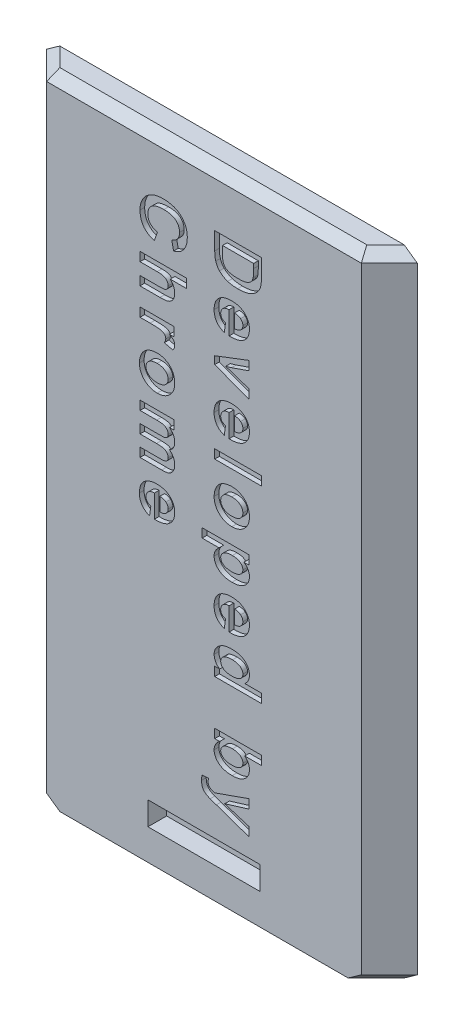
from build123d import *

# Parameters (mm, degrees)
SKETCH1_W           = 39.7
SKETCH1_H           = 68
BOSS_EXTRUDE1_DEPTH = 3
CUT_EXTRUDE2_DEPTH  = 68
SKETCH3_W           = 5
SKETCH3_H           = 0.961538462
CUT_EXTRUDE3_DEPTH  = 0.5
SKETCH4_W           = 12
SKETCH4_H           = 2.5
CUT_EXTRUDE4_DEPTH  = 2
CHAMFER1_SIZE       = 1
CHAMFER2_SIZE       = 1


with BuildPart() as part:
    # Sketch1 → Boss-Extrude1 (new body)
    with BuildSketch(Plane.XY):
        with Locations((19.85, 34)):
            Rectangle(SKETCH1_W, SKETCH1_H)
    extrude(amount=BOSS_EXTRUDE1_DEPTH)

    # Sketch2 → Cut-Extrude2 (cut)
    with BuildSketch(Plane.XZ):
        Polygon((0, 0), (0, 3), (3, 3), align=None)
        Polygon((39.7, 0), (39.7, 3), (36.7, 3), align=None)
    extrude(amount=-CUT_EXTRUDE2_DEPTH, mode=Mode.SUBTRACT)

    # Sketch3 → Cut-Extrude3 (cut)
    # profile 1 of 17: a face of its own
    with BuildSketch(Plane.XY.offset(3)):
        with BuildLine():
            Line((26, 62.173442012), (26, 60.339507718))
            add(Edge.make_bspline(
                [(26, 60.339507718), (26.000025966, 60.289419995), (26.000076528, 60.191887563), (25.994204462, 60.05034247), (25.988297937, 59.917979611), (25.976474364, 59.795178899), (25.964081164, 59.681514302), (25.94839044, 59.576781852), (25.928281059, 59.481643149), (25.912422407, 59.421648738), (25.904847756, 59.392993294)],
                knots=[0, 0, 0, 0, 1.259756885, 2.453039283, 3.563158368, 4.591894114, 5.55549294, 6.43918076, 7.254497783, 8, 8, 8, 8], degree=3))
            add(Edge.make_bspline(
                [(25.904847756, 59.392993294), (25.893186624, 59.357148411), (25.870074404, 59.286104295), (25.829139065, 59.181839032), (25.779800478, 59.082669537), (25.725559888, 58.986296235), (25.664518642, 58.894934907), (25.597978804, 58.806361506), (25.523766113, 58.723196154), (25.418165895, 58.61552284), (25.271040752, 58.493398417), (25.076875026, 58.36424574), (24.862973278, 58.255557211), (24.672048023, 58.179600347), (24.509192149, 58.129379853), (24.378773014, 58.096537844), (24.241506066, 58.068179478), (24.09691869, 58.046928602), (23.945674549, 58.028621668), (23.78732771, 58.015483329), (23.621916382, 58.008978391), (23.509352875, 58.007519613), (23.451923077, 58.006775346)],
                knots=[0, 0, 0, 0, 0.745431882, 1.477436776, 2.212739876, 2.934276521, 3.663147754, 4.384200836, 5.123377481, 5.865761747, 7.365547505, 8.894711587, 10.468722596, 12.101948761, 12.951987285, 13.837595333, 14.760899389, 15.722756883, 16.726861385, 17.773652936, 18.864119771, 20, 20, 20, 20], degree=3))
            add(Edge.make_bspline(
                [(23.451923077, 58.006775346), (23.352692001, 58.008732369), (23.160825361, 58.012516341), (22.88349224, 58.040503197), (22.626724298, 58.086980381), (22.465979309, 58.135532515), (22.388221154, 58.159018935)],
                knots=[0, 0, 0, 0, 1.103491527, 2.133638164, 3.0971734, 4, 4, 4, 4], degree=3))
            add(Edge.make_bspline(
                [(22.388221154, 58.159018935), (22.343627393, 58.174887157), (22.25590451, 58.206102424), (22.129363819, 58.260726801), (22.008941637, 58.319748826), (21.89473284, 58.383658063), (21.787251143, 58.4527774), (21.686818029, 58.527365368), (21.592111268, 58.606265795), (21.533818807, 58.66342459), (21.504807692, 58.6918715)],
                knots=[0, 0, 0, 0, 1.090884612, 2.145940218, 3.175104604, 4.181306866, 5.161203701, 6.118658341, 7.063689906, 8, 8, 8, 8], degree=3))
            add(Edge.make_bspline(
                [(21.504807692, 58.6918715), (21.463498475, 58.738302866), (21.378679231, 58.833639297), (21.271736318, 59.00039689), (21.179567481, 59.189773523), (21.131195835, 59.326342979), (21.106169872, 59.396999705)],
                knots=[0, 0, 0, 0, 0.912008655, 1.872605891, 2.89935344, 4, 4, 4, 4], degree=3))
            add(Edge.make_bspline(
                [(21.106169872, 59.396999705), (21.097386001, 59.425599573), (21.079155531, 59.484957119), (21.059685012, 59.579074361), (21.039172627, 59.679546878), (21.02681565, 59.787533257), (21.013784671, 59.901912548), (21.006468505, 60.023596248), (21.001274452, 60.152162544), (21.000431116, 60.240343014), (21, 60.285421179)],
                knots=[0, 0, 0, 0, 0.799129865, 1.658552685, 2.566799617, 3.538529252, 4.561352959, 5.643373779, 6.795284424, 8, 8, 8, 8], degree=3))
            Line((21, 60.285421179), (21, 62.173442012))
            Line((21, 62.173442012), (26, 62.173442012))
        make_face()
        with BuildLine():
            Line((25.166666667, 61.211903551), (21.833333333, 61.211903551))
            Line((21.833333333, 61.211903551), (21.833333333, 60.420637525))
            add(Edge.make_bspline(
                [(21.833333333, 60.420637525), (21.833616646, 60.384913939), (21.834162131, 60.316132387), (21.835764971, 60.216603721), (21.840104165, 60.125137714), (21.844598862, 60.041255211), (21.852024888, 59.965174592), (21.859328668, 59.896564816), (21.869546504, 59.8358078), (21.877612328, 59.798282773), (21.881410256, 59.780613487)],
                knots=[0, 0, 0, 0, 1.333384787, 2.567275092, 3.714769766, 4.750907381, 5.701951617, 6.567520054, 7.325492842, 8, 8, 8, 8], degree=3))
            add(Edge.make_bspline(
                [(21.881410256, 59.780613487), (21.89245342, 59.739230014), (21.913962589, 59.658625926), (21.961912718, 59.545449637), (22.019759303, 59.443039677), (22.089317334, 59.349680991), (22.177222598, 59.26554549), (22.289646537, 59.193725556), (22.423727945, 59.127258099), (22.552077384, 59.081741169), (22.666716101, 59.049069204), (22.762935206, 59.026952964), (22.867034547, 59.009475097), (22.978603283, 58.994441853), (23.097497942, 58.982294633), (23.224147871, 58.974736059), (23.358398039, 58.969577285), (23.450582363, 58.968742945), (23.497996795, 58.968313807)],
                knots=[0, 0, 0, 0, 1.038686998, 2.023088296, 2.974059649, 3.888265163, 4.839857954, 5.909819677, 7.113156087, 8.466843969, 9.20827164, 10.006482943, 10.861893492, 11.769681931, 12.739021491, 13.762258324, 14.849031541, 16, 16, 16, 16], degree=3))
            add(Edge.make_bspline(
                [(23.497996795, 58.968313807), (23.545411374, 58.968739642), (23.637262346, 58.969564564), (23.770511462, 58.974715461), (23.895167075, 58.982231458), (24.011382892, 58.994465594), (24.119320846, 59.009264422), (24.219067872, 59.026951597), (24.309984022, 59.048919255), (24.417946416, 59.081684697), (24.539738484, 59.130872123), (24.671471051, 59.200003138), (24.785573501, 59.28132915), (24.883447869, 59.37310493), (24.964390849, 59.478539987), (25.03211014, 59.595393993), (25.084690812, 59.726048538), (25.107083709, 59.818993728), (25.118589744, 59.866751307)],
                knots=[0, 0, 0, 0, 1.118059345, 2.165891593, 3.144157881, 4.062285166, 4.920717571, 5.712910489, 6.449981617, 7.12489426, 8.371943983, 9.541298068, 10.624898781, 11.666293176, 12.69306237, 13.747704633, 14.842713931, 16, 16, 16, 16], degree=3))
            add(Edge.make_bspline(
                [(25.118589744, 59.866751307), (25.122431088, 59.887422857), (25.130888258, 59.932933696), (25.140759934, 60.008454993), (25.148144544, 60.097388034), (25.155497359, 60.19953272), (25.159889524, 60.314782462), (25.164297155, 60.443309994), (25.165831631, 60.585231398), (25.166380323, 60.684393176), (25.166666667, 60.736142333)],
                knots=[0, 0, 0, 0, 0.578739524, 1.274162912, 2.095457587, 3.035141998, 4.093102578, 5.270121571, 6.575369351, 8, 8, 8, 8], degree=3))
            Line((25.166666667, 60.736142333), (25.166666667, 61.211903551))
        make_face(mode=Mode.SUBTRACT)
    # profile 2 of 17: a face of its own
    with BuildSketch(Plane.XY.offset(3)):
        with BuildLine():
            Line((22.153846154, 54.199083038), (22.025641026, 53.237544577))
            add(Edge.make_bspline(
                [(22.025641026, 53.237544577), (21.982318726, 53.253271882), (21.897137848, 53.284195117), (21.775680177, 53.340692069), (21.662322101, 53.40384454), (21.556457949, 53.473348925), (21.4579496, 53.548946554), (21.368869253, 53.633137154), (21.285900743, 53.721819349), (21.212994761, 53.818702678), (21.147428112, 53.921359596), (21.090057989, 54.030306), (21.043335136, 54.146413157), (21.004207909, 54.267922831), (20.972976506, 54.395386569), (20.951142686, 54.529324394), (20.937877101, 54.66956447), (20.936565639, 54.76529255), (20.935897436, 54.814067012)],
                knots=[0, 0, 0, 0, 1.071172907, 2.106154283, 3.1104349, 4.085737425, 5.048416355, 5.993087888, 6.932482331, 7.868664062, 8.80754521, 9.762367971, 10.726735429, 11.713584758, 12.728370439, 13.774815933, 14.866245336, 16, 16, 16, 16], degree=3))
            add(Edge.make_bspline(
                [(20.935897436, 54.814067012), (20.937783588, 54.890283279), (20.941446352, 55.03828947), (20.970735776, 55.252452928), (21.018842306, 55.451549618), (21.08501778, 55.635907423), (21.17368707, 55.804045075), (21.280097822, 55.957222753), (21.406138328, 56.095591717), (21.503675373, 56.173166354), (21.552884615, 56.212304192)],
                knots=[0, 0, 0, 0, 1.15090686, 2.234973544, 3.257507168, 4.240282073, 5.185422152, 6.119941203, 7.051475585, 8, 8, 8, 8], degree=3))
            add(Edge.make_bspline(
                [(21.552884615, 56.212304192), (21.594767256, 56.241177908), (21.679106668, 56.299321143), (21.815715528, 56.371749707), (21.960330943, 56.433095794), (22.112207485, 56.484335947), (22.272798669, 56.523210256), (22.44113776, 56.551323198), (22.617957232, 56.567037142), (22.738418563, 56.569580334), (22.799879808, 56.57087791)],
                knots=[0, 0, 0, 0, 0.924739034, 1.862154457, 2.806332648, 3.78003102, 4.774289357, 5.808656063, 6.881942244, 8, 8, 8, 8], degree=3))
            add(Edge.make_bspline(
                [(22.799879808, 56.57087791), (22.872720245, 56.569664855), (23.015079383, 56.567294063), (23.222433137, 56.544977325), (23.417870967, 56.508296623), (23.600596609, 56.456259128), (23.771472037, 56.389873583), (23.93031038, 56.308956381), (24.076692187, 56.212037525), (24.209453363, 56.100898079), (24.328390467, 55.978653699), (24.433273668, 55.848710692), (24.520859079, 55.709918828), (24.593967067, 55.564391245), (24.648688751, 55.409694411), (24.688971434, 55.247767705), (24.713502964, 55.077902251), (24.716451257, 54.962051263), (24.717948718, 54.903209641)],
                knots=[0, 0, 0, 0, 1.22208028, 2.38843015, 3.495001974, 4.555551, 5.572102979, 6.566928721, 7.541284444, 8.51191166, 9.466805643, 10.399597494, 11.308905182, 12.215983304, 13.126946664, 14.056451325, 15.012856426, 16, 16, 16, 16], degree=3))
            add(Edge.make_bspline(
                [(24.717948718, 54.903209641), (24.716556307, 54.837353952), (24.713831505, 54.708481272), (24.688252353, 54.52058479), (24.646644932, 54.343180368), (24.58686547, 54.176837375), (24.511876966, 54.020507734), (24.419046546, 53.875219934), (24.308609331, 53.741289534), (24.182634636, 53.617492368), (24.038287841, 53.507860671), (23.876534647, 53.413162136), (23.696930844, 53.334212024), (23.499678024, 53.270090381), (23.284222106, 53.222717589), (23.051165007, 53.190294354), (22.800515993, 53.171806197), (22.627634315, 53.172885371), (22.538461538, 53.173442012)],
                knots=[0, 0, 0, 0, 0.994914541, 1.946943474, 2.860007193, 3.744253739, 4.613162343, 5.475451996, 6.343187588, 7.231728884, 8.139057486, 9.075471918, 10.058180036, 11.098621179, 12.205332334, 13.387827392, 14.65263521, 16, 16, 16, 16], degree=3))
            Line((22.538461538, 53.173442012), (22.538461538, 55.609339448))
            add(Edge.make_bspline(
                [(22.538461538, 55.609339448), (22.504049397, 55.607750792), (22.437037919, 55.604657168), (22.339022111, 55.593187969), (22.247603705, 55.572494376), (22.160936829, 55.548149688), (22.081293661, 55.514909283), (22.007074558, 55.475475313), (21.938680461, 55.429422291), (21.876812045, 55.376365588), (21.821925583, 55.318217781), (21.77361646, 55.256903749), (21.73179509, 55.192603334), (21.698879511, 55.123731792), (21.67252542, 55.051704968), (21.654867049, 54.975993932), (21.64338546, 54.897215527), (21.641823014, 54.843488888), (21.641025641, 54.816070218)],
                knots=[0, 0, 0, 0, 1.231638706, 2.398395625, 3.522289669, 4.579947828, 5.613000372, 6.600997726, 7.58103015, 8.554716894, 9.508889492, 10.435482506, 11.342805004, 12.245087657, 13.158904806, 14.079635201, 15.019967576, 16, 16, 16, 16], degree=3))
            add(Edge.make_bspline(
                [(21.641025641, 54.816070218), (21.6426439, 54.779573989), (21.645778226, 54.708886241), (21.66773884, 54.606994606), (21.706439286, 54.51454504), (21.7603923, 54.430568818), (21.832041971, 54.355846705), (21.923302306, 54.293199956), (22.031324257, 54.238426108), (22.111661762, 54.21262889), (22.153846154, 54.199083038)],
                knots=[0, 0, 0, 0, 1.004430367, 1.945431754, 2.851730883, 3.749038912, 4.678525969, 5.68064125, 6.782128749, 8, 8, 8, 8], degree=3))
        make_face()
        with BuildLine():
            add(Edge.make_bspline(
                [(23.115384615, 54.134980474), (23.1507985, 54.136623029), (23.219769512, 54.139822019), (23.320266493, 54.150505115), (23.414257095, 54.167974656), (23.501000739, 54.193750059), (23.581662042, 54.223492722), (23.656263463, 54.259292201), (23.72375594, 54.302534469), (23.78359118, 54.352246694), (23.838318086, 54.404632235), (23.883746496, 54.462591452), (23.924852586, 54.521293897), (23.956561305, 54.583954361), (23.982231599, 54.648880139), (24.000222305, 54.716754811), (24.010088329, 54.787738496), (24.011899714, 54.835739775), (24.012820513, 54.86014073)],
                knots=[0, 0, 0, 0, 1.317155349, 2.565252013, 3.752617023, 4.863710936, 5.923691592, 6.944619286, 7.932291025, 8.893346204, 9.832040666, 10.740742434, 11.625065814, 12.490654946, 13.343074709, 14.215747339, 15.092993572, 16, 16, 16, 16], degree=3))
            add(Edge.make_bspline(
                [(24.012820513, 54.86014073), (24.011974118, 54.886215492), (24.010306255, 54.937597112), (23.999423755, 55.012946727), (23.980121744, 55.084367127), (23.953997449, 55.152402608), (23.919594488, 55.216907368), (23.8774035, 55.277882849), (23.827952711, 55.335558446), (23.790488333, 55.370310637), (23.771434295, 55.387985282)],
                knots=[0, 0, 0, 0, 1.043516863, 2.056302107, 3.038302912, 3.998520634, 4.966791607, 5.956307719, 6.960596886, 8, 8, 8, 8], degree=3))
            add(Edge.make_bspline(
                [(23.771434295, 55.387985282), (23.750716943, 55.404450861), (23.7090932, 55.437532261), (23.64013269, 55.47963895), (23.566100638, 55.515748858), (23.486236731, 55.54496007), (23.400986715, 55.566844054), (23.310440431, 55.581448061), (23.214738181, 55.590741219), (23.14912797, 55.591778652), (23.115384615, 55.592312205)],
                knots=[0, 0, 0, 0, 0.903766344, 1.81577923, 2.754803886, 3.715080786, 4.716965023, 5.758108642, 6.846994466, 8, 8, 8, 8], degree=3))
            Line((23.115384615, 55.592312205), (23.115384615, 54.134980474))
        make_face(mode=Mode.SUBTRACT)
    # profile 3 of 17: a face of its own
    with BuildSketch(Plane.XY.offset(3)):
        with BuildLine():
            Line((21, 50.568674384), (24.653846154, 51.961903551))
            Line((24.653846154, 51.961903551), (24.653846154, 51.000365089))
            Line((24.653846154, 51.000365089), (22.788862179, 50.354331435))
            Line((22.788862179, 50.354331435), (22.165865385, 50.167031756))
            add(Edge.make_bspline(
                [(22.165865385, 50.167031756), (22.201876368, 50.155856586), (22.267454011, 50.135506093), (22.356258857, 50.110249008), (22.42439648, 50.089477278), (22.463318709, 50.079144638), (22.479366987, 50.07488432)],
                knots=[0, 0, 0, 0, 1.384535682, 2.521302627, 3.390308653, 4, 4, 4, 4], degree=3))
            add(Edge.make_bspline(
                [(22.479366987, 50.07488432), (22.530868666, 50.059803557), (22.634558275, 50.029441083), (22.737201104, 49.995708428), (22.788862179, 49.978730474)],
                knots=[0, 0, 0, 0, 0.993381684, 2, 2, 2, 2], degree=3))
            Line((22.788862179, 49.978730474), (24.653846154, 49.333698423))
            Line((24.653846154, 49.333698423), (24.653846154, 48.372159961))
            Line((24.653846154, 48.372159961), (21, 49.745357077))
            Line((21, 49.745357077), (21, 50.568674384))
        make_face()
    # profile 4 of 17: a face of its own
    with BuildSketch(Plane.XY.offset(3)):
        with BuildLine():
            Line((22.153846154, 44.6606215), (22.025641026, 43.699083038))
            add(Edge.make_bspline(
                [(22.025641026, 43.699083038), (21.982318726, 43.714810343), (21.897137848, 43.745733578), (21.775680177, 43.80223053), (21.662322101, 43.865383002), (21.556457949, 43.934887386), (21.4579496, 44.010485016), (21.368869253, 44.094675615), (21.285900743, 44.18335781), (21.212994761, 44.28024114), (21.147428112, 44.382898057), (21.090057989, 44.491844461), (21.043335136, 44.607951619), (21.004207909, 44.729461293), (20.972976506, 44.85692503), (20.951142686, 44.990862856), (20.937877101, 45.131102932), (20.936565639, 45.226831011), (20.935897436, 45.275605474)],
                knots=[0, 0, 0, 0, 1.071172907, 2.106154283, 3.1104349, 4.085737425, 5.048416355, 5.993087888, 6.932482331, 7.868664062, 8.80754521, 9.762367971, 10.726735429, 11.713584758, 12.728370439, 13.774815933, 14.866245336, 16, 16, 16, 16], degree=3))
            add(Edge.make_bspline(
                [(20.935897436, 45.275605474), (20.937783588, 45.351821741), (20.941446352, 45.499827932), (20.970735776, 45.71399139), (21.018842306, 45.91308808), (21.08501778, 46.097445885), (21.17368707, 46.265583537), (21.280097822, 46.418761215), (21.406138328, 46.557130179), (21.503675373, 46.634704815), (21.552884615, 46.673842653)],
                knots=[0, 0, 0, 0, 1.15090686, 2.234973544, 3.257507168, 4.240282073, 5.185422152, 6.119941203, 7.051475585, 8, 8, 8, 8], degree=3))
            add(Edge.make_bspline(
                [(21.552884615, 46.673842653), (21.594767256, 46.702716369), (21.679106668, 46.760859605), (21.815715528, 46.833288169), (21.960330943, 46.894634256), (22.112207485, 46.945874408), (22.272798669, 46.984748717), (22.44113776, 47.01286166), (22.617957232, 47.028575603), (22.738418563, 47.031118795), (22.799879808, 47.032416371)],
                knots=[0, 0, 0, 0, 0.924739034, 1.862154457, 2.806332648, 3.78003102, 4.774289357, 5.808656063, 6.881942244, 8, 8, 8, 8], degree=3))
            add(Edge.make_bspline(
                [(22.799879808, 47.032416371), (22.872720245, 47.031203316), (23.015079383, 47.028832525), (23.222433137, 47.006515786), (23.417870967, 46.969835084), (23.600596609, 46.91779759), (23.771472037, 46.851412045), (23.93031038, 46.770494843), (24.076692187, 46.673575986), (24.209453363, 46.562436541), (24.328390467, 46.440192161), (24.433273668, 46.310249154), (24.520859079, 46.17145729), (24.593967067, 46.025929706), (24.648688751, 45.871232873), (24.688971434, 45.709306166), (24.713502964, 45.539440713), (24.716451257, 45.423589725), (24.717948718, 45.364748102)],
                knots=[0, 0, 0, 0, 1.22208028, 2.38843015, 3.495001974, 4.555551, 5.572102979, 6.566928721, 7.541284444, 8.51191166, 9.466805643, 10.399597494, 11.308905182, 12.215983304, 13.126946664, 14.056451325, 15.012856426, 16, 16, 16, 16], degree=3))
            add(Edge.make_bspline(
                [(24.717948718, 45.364748102), (24.716556307, 45.298892413), (24.713831505, 45.170019733), (24.688252353, 44.982123251), (24.646644932, 44.804718829), (24.58686547, 44.638375836), (24.511876966, 44.482046196), (24.419046546, 44.336758396), (24.308609331, 44.202827995), (24.182634636, 44.079030829), (24.038287841, 43.969399132), (23.876534647, 43.874700598), (23.696930844, 43.795750485), (23.499678024, 43.731628842), (23.284222106, 43.684256051), (23.051165007, 43.651832815), (22.800515993, 43.633344658), (22.627634315, 43.634423833), (22.538461538, 43.634980474)],
                knots=[0, 0, 0, 0, 0.994914541, 1.946943474, 2.860007193, 3.744253739, 4.613162343, 5.475451996, 6.343187588, 7.231728884, 8.139057486, 9.075471918, 10.058180036, 11.098621179, 12.205332334, 13.387827392, 14.65263521, 16, 16, 16, 16], degree=3))
            Line((22.538461538, 43.634980474), (22.538461538, 46.07087791))
            add(Edge.make_bspline(
                [(22.538461538, 46.07087791), (22.504049397, 46.069289253), (22.437037919, 46.06619563), (22.339022111, 46.05472643), (22.247603705, 46.034032837), (22.160936829, 46.009688149), (22.081293661, 45.976447744), (22.007074558, 45.937013775), (21.938680461, 45.890960752), (21.876812045, 45.837904049), (21.821925583, 45.779756243), (21.77361646, 45.718442211), (21.73179509, 45.654141796), (21.698879511, 45.585270254), (21.67252542, 45.513243429), (21.654867049, 45.437532394), (21.64338546, 45.358753989), (21.641823014, 45.305027349), (21.641025641, 45.277608679)],
                knots=[0, 0, 0, 0, 1.231638706, 2.398395625, 3.522289669, 4.579947828, 5.613000372, 6.600997726, 7.58103015, 8.554716894, 9.508889492, 10.435482506, 11.342805004, 12.245087657, 13.158904806, 14.079635201, 15.019967576, 16, 16, 16, 16], degree=3))
            add(Edge.make_bspline(
                [(21.641025641, 45.277608679), (21.6426439, 45.241112451), (21.645778226, 45.170424702), (21.66773884, 45.068533068), (21.706439286, 44.976083501), (21.7603923, 44.892107279), (21.832041971, 44.817385167), (21.923302306, 44.754738417), (22.031324257, 44.699964569), (22.111661762, 44.674167351), (22.153846154, 44.6606215)],
                knots=[0, 0, 0, 0, 1.004430367, 1.945431754, 2.851730883, 3.749038912, 4.678525969, 5.68064125, 6.782128749, 8, 8, 8, 8], degree=3))
        make_face()
        with BuildLine():
            add(Edge.make_bspline(
                [(23.115384615, 44.596518935), (23.1507985, 44.59816149), (23.219769512, 44.601360481), (23.320266493, 44.612043577), (23.414257095, 44.629513117), (23.501000739, 44.655288521), (23.581662042, 44.685031184), (23.656263463, 44.720830663), (23.72375594, 44.76407293), (23.78359118, 44.813785156), (23.838318086, 44.866170696), (23.883746496, 44.924129914), (23.924852586, 44.982832359), (23.956561305, 45.045492822), (23.982231599, 45.1104186), (24.000222305, 45.178293272), (24.010088329, 45.249276957), (24.011899714, 45.297278237), (24.012820513, 45.321679192)],
                knots=[0, 0, 0, 0, 1.317155349, 2.565252013, 3.752617023, 4.863710936, 5.923691592, 6.944619286, 7.932291025, 8.893346204, 9.832040666, 10.740742434, 11.625065814, 12.490654946, 13.343074709, 14.215747339, 15.092993572, 16, 16, 16, 16], degree=3))
            add(Edge.make_bspline(
                [(24.012820513, 45.321679192), (24.011974118, 45.347753953), (24.010306255, 45.399135574), (23.999423755, 45.474485189), (23.980121744, 45.545905589), (23.953997449, 45.61394107), (23.919594488, 45.67844583), (23.8774035, 45.739421311), (23.827952711, 45.797096908), (23.790488333, 45.831849098), (23.771434295, 45.849523743)],
                knots=[0, 0, 0, 0, 1.043516863, 2.056302107, 3.038302912, 3.998520634, 4.966791607, 5.956307719, 6.960596886, 8, 8, 8, 8], degree=3))
            add(Edge.make_bspline(
                [(23.771434295, 45.849523743), (23.750716943, 45.865989322), (23.7090932, 45.899070723), (23.64013269, 45.941177411), (23.566100638, 45.97728732), (23.486236731, 46.006498531), (23.400986715, 46.028382516), (23.310440431, 46.042986523), (23.214738181, 46.05227968), (23.14912797, 46.053317114), (23.115384615, 46.053850666)],
                knots=[0, 0, 0, 0, 0.903766344, 1.81577923, 2.754803886, 3.715080786, 4.716965023, 5.758108642, 6.846994466, 8, 8, 8, 8], degree=3))
            Line((23.115384615, 46.053850666), (23.115384615, 44.596518935))
        make_face(mode=Mode.SUBTRACT)
    # profile 5 of 17: a face of its own
    with BuildSketch(Plane.XY.offset(3)):
        with Locations((23.5, 41.461903551)):
            Rectangle(SKETCH3_W, SKETCH3_H)
    # profile 6 of 17: a face of its own
    with BuildSketch(Plane.XY.offset(3)):
        with BuildLine():
            add(Edge.make_bspline(
                [(22.878004808, 39.352929192), (22.956968885, 39.349822823), (23.115050102, 39.343604064), (23.350071388, 39.299795489), (23.579966537, 39.223819046), (23.766155879, 39.139665774), (23.910130492, 39.059149608), (24.011728339, 38.990825954), (24.107944755, 38.91785949), (24.195976589, 38.837021132), (24.278406537, 38.751065008), (24.353756707, 38.658607037), (24.421882417, 38.55985649), (24.484108551, 38.45594275), (24.538388136, 38.347089066), (24.58741492, 38.235506009), (24.627003692, 38.120047606), (24.660112723, 38.001666758), (24.686615547, 37.880016518), (24.70397954, 37.755096909), (24.71555441, 37.627050054), (24.71714327, 37.540722197), (24.717948718, 37.496959641)],
                knots=[0, 0, 0, 0, 1.620086906, 3.24331412, 4.885542897, 6.578005083, 7.427771567, 8.267621014, 9.088420958, 9.9031946, 10.717276681, 11.530464626, 12.347654122, 13.177156876, 14.013590352, 14.842102317, 15.676260085, 16.515690285, 17.363576751, 18.228778874, 19.102107167, 20, 20, 20, 20], degree=3))
            add(Edge.make_bspline(
                [(24.717948718, 37.496959641), (24.716525785, 37.430441346), (24.713726583, 37.299586253), (24.688239392, 37.108018518), (24.646225992, 36.925913006), (24.587807811, 36.752966422), (24.512508271, 36.588997734), (24.41994816, 36.434350636), (24.310916196, 36.288931583), (24.186182703, 36.154935172), (24.049459949, 36.032616696), (23.902074598, 35.92617344), (23.745509178, 35.836936519), (23.581431222, 35.761605125), (23.40760844, 35.704726009), (23.224940809, 35.665339914), (23.034017461, 35.638990254), (22.903469592, 35.636334111), (22.836939103, 35.634980474)],
                knots=[0, 0, 0, 0, 1.075924834, 2.116564253, 3.120359295, 4.095843642, 5.065160291, 6.034266158, 7.006679049, 8.000613031, 8.991650547, 9.970718501, 10.936294465, 11.903365421, 12.887384013, 13.888792113, 14.924075166, 16, 16, 16, 16], degree=3))
            add(Edge.make_bspline(
                [(22.836939103, 35.634980474), (22.769742464, 35.636336409), (22.638198597, 35.638990783), (22.445523642, 35.665227041), (22.261164284, 35.705607045), (22.085990141, 35.764182557), (21.918572725, 35.837311967), (21.761260347, 35.929193249), (21.612329007, 36.036885585), (21.473627486, 36.159555348), (21.34810379, 36.295316701), (21.237175577, 36.440377888), (21.144818605, 36.595049387), (21.067828926, 36.75710002), (21.008498197, 36.928435121), (20.967189022, 37.108462783), (20.939678285, 37.296795593), (20.93717369, 37.425411734), (20.935897436, 37.490950025)],
                knots=[0, 0, 0, 0, 1.084214369, 2.122453651, 3.133245126, 4.126920621, 5.099393651, 6.077466609, 7.061801406, 8.062192921, 9.061451275, 10.042415863, 11.00466351, 11.964250754, 12.934136361, 13.925118567, 14.942712938, 16, 16, 16, 16], degree=3))
            add(Edge.make_bspline(
                [(20.935897436, 37.490950025), (20.938572187, 37.572592983), (20.943902659, 37.735297984), (20.987617237, 37.976070904), (21.058170428, 38.210881688), (21.139313592, 38.400104055), (21.218585352, 38.544543386), (21.284790453, 38.647035604), (21.357361349, 38.742851907), (21.436413257, 38.832255627), (21.522825566, 38.914314645), (21.61519276, 38.98972091), (21.714104342, 39.058175596), (21.819197304, 39.120093035), (21.930659631, 39.175865531), (22.049199922, 39.22187954), (22.172487381, 39.263787096), (22.302120707, 39.296620011), (22.437706739, 39.321390404), (22.579147296, 39.339277932), (22.726582313, 39.350518224), (22.826902794, 39.352115539), (22.878004808, 39.352929192)],
                knots=[0, 0, 0, 0, 1.611045457, 3.210627817, 4.814333868, 6.444163167, 7.264332963, 8.065176076, 8.850929033, 9.63538137, 10.418669626, 11.201097567, 11.987375694, 12.791170411, 13.607756286, 14.445019158, 15.299668816, 16.177394151, 17.082417834, 18.019405111, 18.991109422, 20, 20, 20, 20], degree=3))
        make_face()
        with BuildLine():
            add(Edge.make_bspline(
                [(22.826923077, 38.39139073), (22.780485166, 38.390678104), (22.69011698, 38.389291332), (22.558636966, 38.376931459), (22.435169684, 38.357774291), (22.320862887, 38.328190293), (22.214171924, 38.292514895), (22.116515796, 38.247228864), (22.026045004, 38.195481503), (21.946143785, 38.133896358), (21.875415218, 38.066774525), (21.8125689, 37.996424327), (21.759055689, 37.922155755), (21.715548085, 37.843512649), (21.682518966, 37.760592218), (21.658282384, 37.674373043), (21.644044107, 37.584235036), (21.642042864, 37.523051128), (21.641025641, 37.491951628)],
                knots=[0, 0, 0, 0, 1.334287467, 2.596523749, 3.792235791, 4.920928783, 5.98599801, 7.020725633, 8.009778093, 8.975087571, 9.91178927, 10.809031968, 11.682407688, 12.537028737, 13.385161363, 14.241880569, 15.106355953, 16, 16, 16, 16], degree=3))
            add(Edge.make_bspline(
                [(21.641025641, 37.491951628), (21.642039525, 37.46085078), (21.6440342, 37.399664219), (21.658320365, 37.309545547), (21.682295127, 37.223552985), (21.715817967, 37.141169588), (21.759016194, 37.062729961), (21.812604716, 36.988507635), (21.875156002, 36.918208176), (21.946266163, 36.851632168), (22.027255351, 36.791828802), (22.117443711, 36.73957435), (22.215473657, 36.694289717), (22.322730529, 36.658449482), (22.43835283, 36.63048685), (22.562622037, 36.610876889), (22.695466673, 36.598616785), (22.7868309, 36.597232574), (22.833934295, 36.596518935)],
                knots=[0, 0, 0, 0, 0.891374549, 1.753654511, 2.608197993, 3.445305504, 4.297756158, 5.168913853, 6.063877914, 6.991658187, 7.956416983, 8.942957645, 9.975057474, 11.046479855, 12.179282068, 13.381405243, 14.649967197, 16, 16, 16, 16], degree=3))
            add(Edge.make_bspline(
                [(22.833934295, 36.596518935), (22.880035625, 36.597236116), (22.969399563, 36.598626315), (23.099263032, 36.610817296), (23.221126748, 36.630754826), (23.334867735, 36.658234988), (23.440680276, 36.694475739), (23.537585696, 36.739857886), (23.627511597, 36.791485218), (23.707653296, 36.851981742), (23.778721288, 36.918165893), (23.841233459, 36.988518469), (23.894832023, 37.062727158), (23.93802765, 37.141170316), (23.971551173, 37.223552787), (23.995525749, 37.309545601), (24.009811964, 37.399664205), (24.011806632, 37.460850775), (24.012820513, 37.491951628)],
                knots=[0, 0, 0, 0, 1.332105243, 2.582185114, 3.76554119, 4.898206757, 5.96011018, 6.991864232, 7.986448439, 8.951336849, 9.886681577, 10.788942532, 11.667203022, 12.526603947, 13.370536632, 14.232047448, 15.101357822, 16, 16, 16, 16], degree=3))
            add(Edge.make_bspline(
                [(24.012820513, 37.491951628), (24.01180329, 37.523051128), (24.009802047, 37.584235036), (23.99556377, 37.674373043), (23.971327188, 37.760592218), (23.938298068, 37.843512649), (23.894790465, 37.922155755), (23.841277254, 37.996424327), (23.778430936, 38.066774525), (23.707702368, 38.133896358), (23.62780115, 38.195481503), (23.537330358, 38.247228864), (23.43967423, 38.292514895), (23.332983267, 38.328190293), (23.218676469, 38.357774291), (23.095209188, 38.376931459), (22.963729174, 38.389291332), (22.873360988, 38.390678104), (22.826923077, 38.39139073)],
                knots=[0, 0, 0, 0, 0.893644047, 1.758119431, 2.614838637, 3.462971263, 4.317592312, 5.190968032, 6.08821073, 7.024912429, 7.990221907, 8.979274367, 10.01400199, 11.079071217, 12.207764209, 13.403476251, 14.665712533, 16, 16, 16, 16], degree=3))
        make_face(mode=Mode.SUBTRACT)
    # profile 7 of 17: a face of its own
    with BuildSketch(Plane.XY.offset(3)):
        with BuildLine():
            Line((24.653846154, 33.942672782), (24.653846154, 32.98113432))
            Line((24.653846154, 32.98113432), (24.127003205, 32.98113432))
            add(Edge.make_bspline(
                [(24.127003205, 32.98113432), (24.170552788, 32.952518871), (24.25741479, 32.895443808), (24.373116382, 32.790169661), (24.473637353, 32.669468939), (24.560813098, 32.536774994), (24.631262504, 32.392604792), (24.681236237, 32.239237787), (24.712493283, 32.078287198), (24.716110114, 31.968323856), (24.717948718, 31.912424384)],
                knots=[0, 0, 0, 0, 0.978547196, 1.95176541, 2.927409496, 3.924956672, 4.929940552, 5.934297003, 6.949907262, 8, 8, 8, 8], degree=3))
            add(Edge.make_bspline(
                [(24.717948718, 31.912424384), (24.716375993, 31.863587014), (24.713266634, 31.767032995), (24.689523287, 31.625251127), (24.651502657, 31.488665547), (24.597121741, 31.357760418), (24.526281958, 31.233075045), (24.44056379, 31.114263526), (24.339254374, 31.001458548), (24.223959873, 30.89497919), (24.09443324, 30.797492951), (23.952194919, 30.712304994), (23.797102154, 30.64113108), (23.630714449, 30.581640683), (23.451325851, 30.537520307), (23.260673264, 30.504015379), (23.057656492, 30.485485828), (22.918437844, 30.482610616), (22.846955128, 30.48113432)],
                knots=[0, 0, 0, 0, 0.889183518, 1.757962001, 2.610823862, 3.466866804, 4.332788647, 5.217155532, 6.130223362, 7.089913047, 8.071415563, 9.077827182, 10.103546864, 11.174887114, 12.291391641, 13.464112916, 14.69793237, 16, 16, 16, 16], degree=3))
            add(Edge.make_bspline(
                [(22.846955128, 30.48113432), (22.773451623, 30.48245745), (22.630501088, 30.485030689), (22.422708085, 30.50558085), (22.227071144, 30.537452749), (22.044581871, 30.586481167), (21.87326216, 30.645544989), (21.715391515, 30.720207186), (21.569630739, 30.807575747), (21.438315076, 30.908866412), (21.320257404, 31.018533881), (21.217262879, 31.135105734), (21.130667129, 31.25773511), (21.059792797, 31.386074287), (21.004457766, 31.52015477), (20.96391722, 31.659719738), (20.940651454, 31.805473963), (20.937497691, 31.90433069), (20.935897436, 31.954491692)],
                knots=[0, 0, 0, 0, 1.306276956, 2.54046374, 3.708317787, 4.825351227, 5.895229917, 6.925275359, 7.923721025, 8.910100439, 9.867470588, 10.784172372, 11.670002506, 12.530604141, 13.384735846, 14.243124713, 15.108541968, 16, 16, 16, 16], degree=3))
            add(Edge.make_bspline(
                [(20.935897436, 31.954491692), (20.936954166, 32.002021145), (20.939028774, 32.095332559), (20.964006867, 32.23135974), (20.998563596, 32.361510971), (21.052750955, 32.485776858), (21.124615795, 32.60765644), (21.21575593, 32.731536475), (21.328617727, 32.857724797), (21.414675747, 32.938723526), (21.459735577, 32.98113432)],
                knots=[0, 0, 0, 0, 0.955822701, 1.876503125, 2.776905967, 3.662325514, 4.596312032, 5.620965962, 6.754341905, 8, 8, 8, 8], degree=3))
            Line((21.459735577, 32.98113432), (19.653846154, 32.98113432))
            Line((19.653846154, 32.98113432), (19.653846154, 33.942672782))
            Line((19.653846154, 33.942672782), (24.653846154, 33.942672782))
        make_face()
        with BuildLine():
            add(Edge.make_bspline(
                [(22.889022436, 32.98113432), (22.837592827, 32.980224907), (22.737973629, 32.978463372), (22.593776761, 32.968956912), (22.459813457, 32.951304645), (22.336578736, 32.924748953), (22.222793331, 32.893821086), (22.120055361, 32.853224237), (22.02730488, 32.806681051), (21.94587907, 32.752061052), (21.874349045, 32.692664383), (21.812377518, 32.62980779), (21.759278364, 32.563947399), (21.715893274, 32.494818016), (21.682765296, 32.421916777), (21.658135897, 32.346107059), (21.644180983, 32.266836405), (21.642081425, 32.212956138), (21.641025641, 32.185861884)],
                knots=[0, 0, 0, 0, 1.493314022, 2.892550594, 4.193549699, 5.412205958, 6.550654332, 7.612709232, 8.614154521, 9.557822924, 10.452682187, 11.309508678, 12.116407821, 12.904513946, 13.672267114, 14.435601522, 15.213325928, 16, 16, 16, 16], degree=3))
            add(Edge.make_bspline(
                [(21.641025641, 32.185861884), (21.641704621, 32.159765199), (21.643045332, 32.108234807), (21.656412328, 32.03282186), (21.678563348, 31.960770718), (21.710174149, 31.892481389), (21.749098303, 31.826807162), (21.797998147, 31.765248596), (21.855603979, 31.70750656), (21.920549884, 31.651179583), (21.997521126, 31.602614239), (22.084665195, 31.559153753), (22.182862052, 31.522081942), (22.292872724, 31.493869276), (22.4136427, 31.470838736), (22.545418358, 31.454115617), (22.688541681, 31.443990347), (22.78750898, 31.443123357), (22.838942308, 31.442672782)],
                knots=[0, 0, 0, 0, 0.791436533, 1.562766886, 2.315979036, 3.073269983, 3.841398674, 4.627954771, 5.451998839, 6.314818792, 7.231140921, 8.205467689, 9.266952699, 10.409907015, 11.648037837, 12.996681567, 14.439174734, 16, 16, 16, 16], degree=3))
            add(Edge.make_bspline(
                [(22.838942308, 31.442672782), (22.887049206, 31.442998938), (22.98006308, 31.443629556), (23.11472324, 31.455552526), (23.240014303, 31.471588239), (23.355630318, 31.496160873), (23.462407724, 31.525102971), (23.558647399, 31.563673309), (23.645995407, 31.607532671), (23.723033735, 31.659050498), (23.791597695, 31.714700097), (23.849436017, 31.775628395), (23.900640324, 31.837744418), (23.942003049, 31.903970265), (23.973105361, 31.974327389), (23.996527757, 32.047053974), (24.009563255, 32.123637791), (24.011720682, 32.175466078), (24.012820513, 32.201887525)],
                knots=[0, 0, 0, 0, 1.476459806, 2.854710082, 4.147877, 5.352136794, 6.481419541, 7.539804139, 8.530071065, 9.476830027, 10.379846701, 11.23529603, 12.051777807, 12.848258948, 13.623682229, 14.408266492, 15.188553102, 16, 16, 16, 16], degree=3))
            add(Edge.make_bspline(
                [(24.012820513, 32.201887525), (24.012276542, 32.229338631), (24.011207492, 32.28328753), (23.996006817, 32.362098714), (23.974267183, 32.437844436), (23.943430147, 32.510155631), (23.902262664, 32.577699027), (23.854036617, 32.642808943), (23.795589958, 32.703305861), (23.729298068, 32.760869087), (23.654063494, 32.813151233), (23.56951575, 32.858051077), (23.4766774, 32.895772451), (23.376162336, 32.928425803), (23.266346941, 32.951918652), (23.148150537, 32.968295055), (23.021470706, 32.980148078), (22.934124228, 32.980798481), (22.889022436, 32.98113432)],
                knots=[0, 0, 0, 0, 0.85812159, 1.686442648, 2.503408574, 3.322778131, 4.138405645, 4.97460315, 5.854412976, 6.765937777, 7.719865152, 8.715925653, 9.756353289, 10.85381274, 12.020422519, 13.266547949, 14.588568337, 16, 16, 16, 16], degree=3))
        make_face(mode=Mode.SUBTRACT)
    # profile 8 of 17: a face of its own
    with BuildSketch(Plane.XY.offset(3)):
        with BuildLine():
            Line((22.153846154, 26.737544577), (22.025641026, 25.776006115))
            add(Edge.make_bspline(
                [(22.025641026, 25.776006115), (21.982318726, 25.79173342), (21.897137848, 25.822656655), (21.775680177, 25.879153607), (21.662322101, 25.942306079), (21.556457949, 26.011810463), (21.4579496, 26.087408093), (21.368869253, 26.171598692), (21.285900743, 26.260280887), (21.212994761, 26.357164217), (21.147428112, 26.459821134), (21.090057989, 26.568767538), (21.043335136, 26.684874696), (21.004207909, 26.80638437), (20.972976506, 26.933848107), (20.951142686, 27.067785933), (20.937877101, 27.208026009), (20.936565639, 27.303754088), (20.935897436, 27.352528551)],
                knots=[0, 0, 0, 0, 1.071172907, 2.106154283, 3.1104349, 4.085737425, 5.048416355, 5.993087888, 6.932482331, 7.868664062, 8.80754521, 9.762367971, 10.726735429, 11.713584758, 12.728370439, 13.774815933, 14.866245336, 16, 16, 16, 16], degree=3))
            add(Edge.make_bspline(
                [(20.935897436, 27.352528551), (20.937783588, 27.428744818), (20.941446352, 27.576751009), (20.970735776, 27.790914467), (21.018842306, 27.990011157), (21.08501778, 28.174368962), (21.17368707, 28.342506614), (21.280097822, 28.495684292), (21.406138328, 28.634053256), (21.503675373, 28.711627892), (21.552884615, 28.75076573)],
                knots=[0, 0, 0, 0, 1.15090686, 2.234973544, 3.257507168, 4.240282073, 5.185422152, 6.119941203, 7.051475585, 8, 8, 8, 8], degree=3))
            add(Edge.make_bspline(
                [(21.552884615, 28.75076573), (21.594767256, 28.779639446), (21.679106668, 28.837782681), (21.815715528, 28.910211246), (21.960330943, 28.971557333), (22.112207485, 29.022797485), (22.272798669, 29.061671794), (22.44113776, 29.089784737), (22.617957232, 29.10549868), (22.738418563, 29.108041872), (22.799879808, 29.109339448)],
                knots=[0, 0, 0, 0, 0.924739034, 1.862154457, 2.806332648, 3.78003102, 4.774289357, 5.808656063, 6.881942244, 8, 8, 8, 8], degree=3))
            add(Edge.make_bspline(
                [(22.799879808, 29.109339448), (22.872720245, 29.108126393), (23.015079383, 29.105755602), (23.222433137, 29.083438863), (23.417870967, 29.046758161), (23.600596609, 28.994720667), (23.771472037, 28.928335122), (23.93031038, 28.84741792), (24.076692187, 28.750499063), (24.209453363, 28.639359618), (24.328390467, 28.517115238), (24.433273668, 28.387172231), (24.520859079, 28.248380367), (24.593967067, 28.102852783), (24.648688751, 27.94815595), (24.688971434, 27.786229243), (24.713502964, 27.616363789), (24.716451257, 27.500512802), (24.717948718, 27.441671179)],
                knots=[0, 0, 0, 0, 1.22208028, 2.38843015, 3.495001974, 4.555551, 5.572102979, 6.566928721, 7.541284444, 8.51191166, 9.466805643, 10.399597494, 11.308905182, 12.215983304, 13.126946664, 14.056451325, 15.012856426, 16, 16, 16, 16], degree=3))
            add(Edge.make_bspline(
                [(24.717948718, 27.441671179), (24.716556307, 27.37581549), (24.713831505, 27.24694281), (24.688252353, 27.059046328), (24.646644932, 26.881641906), (24.58686547, 26.715298913), (24.511876966, 26.558969273), (24.419046546, 26.413681472), (24.308609331, 26.279751072), (24.182634636, 26.155953906), (24.038287841, 26.046322209), (23.876534647, 25.951623675), (23.696930844, 25.872673562), (23.499678024, 25.808551919), (23.284222106, 25.761179128), (23.051165007, 25.728755892), (22.800515993, 25.710267735), (22.627634315, 25.71134691), (22.538461538, 25.711903551)],
                knots=[0, 0, 0, 0, 0.994914541, 1.946943474, 2.860007193, 3.744253739, 4.613162343, 5.475451996, 6.343187588, 7.231728884, 8.139057486, 9.075471918, 10.058180036, 11.098621179, 12.205332334, 13.387827392, 14.65263521, 16, 16, 16, 16], degree=3))
            Line((22.538461538, 25.711903551), (22.538461538, 28.147800987))
            add(Edge.make_bspline(
                [(22.538461538, 28.147800987), (22.504049397, 28.14621233), (22.437037919, 28.143118706), (22.339022111, 28.131649507), (22.247603705, 28.110955914), (22.160936829, 28.086611226), (22.081293661, 28.053370821), (22.007074558, 28.013936852), (21.938680461, 27.967883829), (21.876812045, 27.914827126), (21.821925583, 27.85667932), (21.77361646, 27.795365288), (21.73179509, 27.731064873), (21.698879511, 27.662193331), (21.67252542, 27.590166506), (21.654867049, 27.514455471), (21.64338546, 27.435677066), (21.641823014, 27.381950426), (21.641025641, 27.354531756)],
                knots=[0, 0, 0, 0, 1.231638706, 2.398395625, 3.522289669, 4.579947828, 5.613000372, 6.600997726, 7.58103015, 8.554716894, 9.508889492, 10.435482506, 11.342805004, 12.245087657, 13.158904806, 14.079635201, 15.019967576, 16, 16, 16, 16], degree=3))
            add(Edge.make_bspline(
                [(21.641025641, 27.354531756), (21.6426439, 27.318035528), (21.645778226, 27.247347779), (21.66773884, 27.145456144), (21.706439286, 27.053006578), (21.7603923, 26.969030356), (21.832041971, 26.894308244), (21.923302306, 26.831661494), (22.031324257, 26.776887646), (22.111661762, 26.751090428), (22.153846154, 26.737544577)],
                knots=[0, 0, 0, 0, 1.004430367, 1.945431754, 2.851730883, 3.749038912, 4.678525969, 5.68064125, 6.782128749, 8, 8, 8, 8], degree=3))
        make_face()
        with BuildLine():
            add(Edge.make_bspline(
                [(23.115384615, 26.673442012), (23.1507985, 26.675084567), (23.219769512, 26.678283558), (23.320266493, 26.688966654), (23.414257095, 26.706436194), (23.501000739, 26.732211597), (23.581662042, 26.761954261), (23.656263463, 26.79775374), (23.72375594, 26.840996007), (23.78359118, 26.890708233), (23.838318086, 26.943093773), (23.883746496, 27.001052991), (23.924852586, 27.059755436), (23.956561305, 27.122415899), (23.982231599, 27.187341677), (24.000222305, 27.255216349), (24.010088329, 27.326200034), (24.011899714, 27.374201314), (24.012820513, 27.398602269)],
                knots=[0, 0, 0, 0, 1.317155349, 2.565252013, 3.752617023, 4.863710936, 5.923691592, 6.944619286, 7.932291025, 8.893346204, 9.832040666, 10.740742434, 11.625065814, 12.490654946, 13.343074709, 14.215747339, 15.092993572, 16, 16, 16, 16], degree=3))
            add(Edge.make_bspline(
                [(24.012820513, 27.398602269), (24.011974118, 27.42467703), (24.010306255, 27.476058651), (23.999423755, 27.551408266), (23.980121744, 27.622828666), (23.953997449, 27.690864147), (23.919594488, 27.755368907), (23.8774035, 27.816344388), (23.827952711, 27.874019985), (23.790488333, 27.908772175), (23.771434295, 27.92644682)],
                knots=[0, 0, 0, 0, 1.043516863, 2.056302107, 3.038302912, 3.998520634, 4.966791607, 5.956307719, 6.960596886, 8, 8, 8, 8], degree=3))
            add(Edge.make_bspline(
                [(23.771434295, 27.92644682), (23.750716943, 27.942912399), (23.7090932, 27.9759938), (23.64013269, 28.018100488), (23.566100638, 28.054210397), (23.486236731, 28.083421608), (23.400986715, 28.105305593), (23.310440431, 28.1199096), (23.214738181, 28.129202757), (23.14912797, 28.130240191), (23.115384615, 28.130773743)],
                knots=[0, 0, 0, 0, 0.903766344, 1.81577923, 2.754803886, 3.715080786, 4.716965023, 5.758108642, 6.846994466, 8, 8, 8, 8], degree=3))
            Line((23.115384615, 28.130773743), (23.115384615, 26.673442012))
        make_face(mode=Mode.SUBTRACT)
    # profile 9 of 17: a face of its own
    with BuildSketch(Plane.XY.offset(3)):
        with BuildLine():
            Line((21, 20.814467653), (21, 21.776006115))
            Line((21, 21.776006115), (21.527844551, 21.776006115))
            add(Edge.make_bspline(
                [(21.527844551, 21.776006115), (21.478701474, 21.811105958), (21.383184239, 21.879327978), (21.260699554, 22.000972161), (21.155696541, 22.128664617), (21.074752353, 22.267425068), (21.013200304, 22.410130265), (20.968409528, 22.554445397), (20.941409049, 22.699807211), (20.937730227, 22.79719766), (20.935897436, 22.845717653)],
                knots=[0, 0, 0, 0, 1.136250633, 2.208480306, 3.242140302, 4.243453007, 5.224054853, 6.165360536, 7.085981264, 8, 8, 8, 8], degree=3))
            add(Edge.make_bspline(
                [(20.935897436, 22.845717653), (20.937547234, 22.89386963), (20.940820002, 22.989390533), (20.963588898, 23.129965278), (21.004922796, 23.264628581), (21.059741268, 23.394244834), (21.131104815, 23.518599727), (21.216936694, 23.638162211), (21.321096031, 23.750597976), (21.437926765, 23.85857437), (21.570379334, 23.956300459), (21.714870005, 24.043064613), (21.872598854, 24.115238661), (22.04238963, 24.174123317), (22.224714499, 24.220098195), (22.419269505, 24.252984645), (22.626235961, 24.271684922), (22.768124997, 24.274540547), (22.840945513, 24.276006115)],
                knots=[0, 0, 0, 0, 0.868648501, 1.723171011, 2.559673551, 3.404311178, 4.256708429, 5.141022567, 6.053421624, 7.016874724, 8.007066608, 9.017279046, 10.052112795, 11.130245488, 12.255062737, 13.440307706, 14.686310657, 16, 16, 16, 16], degree=3))
            add(Edge.make_bspline(
                [(22.840945513, 24.276006115), (22.915434423, 24.274548803), (23.059989185, 24.271720712), (23.269973637, 24.253121057), (23.465871266, 24.220188898), (23.648231685, 24.174269214), (23.817060033, 24.115391014), (23.972645618, 24.043457172), (24.113384837, 23.956801271), (24.240020112, 23.858346013), (24.35203226, 23.750152387), (24.450083633, 23.634598586), (24.532550643, 23.511381487), (24.601523689, 23.381931345), (24.653753347, 23.244494923), (24.690218861, 23.100604354), (24.714747369, 22.950052323), (24.716866937, 22.847153319), (24.717948718, 22.794635923)],
                knots=[0, 0, 0, 0, 1.327256874, 2.57570292, 3.752231218, 4.863210148, 5.922464215, 6.933776268, 7.911206958, 8.860796611, 9.786380352, 10.681367744, 11.55583499, 12.423333935, 13.289506038, 14.168212318, 15.065095705, 16, 16, 16, 16], degree=3))
            add(Edge.make_bspline(
                [(24.717948718, 22.794635923), (24.716388292, 22.746129951), (24.713313972, 22.650564461), (24.689446681, 22.509715632), (24.650753035, 22.374022451), (24.594415796, 22.243796858), (24.52426811, 22.117789786), (24.437440296, 21.997618502), (24.335450041, 21.882130084), (24.257933459, 21.811999674), (24.218149038, 21.776006115)],
                knots=[0, 0, 0, 0, 0.992399448, 1.955205421, 2.915485871, 3.87381908, 4.85285833, 5.861755538, 6.90257267, 8, 8, 8, 8], degree=3))
            Line((24.218149038, 21.776006115), (26, 21.776006115))
            Line((26, 21.776006115), (26, 20.814467653))
            Line((26, 20.814467653), (21, 20.814467653))
        make_face()
        with BuildLine():
            add(Edge.make_bspline(
                [(22.896033654, 23.314467653), (22.847607935, 23.314309819), (22.754354754, 23.314005877), (22.619739884, 23.305363106), (22.495777242, 23.293606346), (22.381874204, 23.278292798), (22.278473247, 23.256251602), (22.185528557, 23.229246452), (22.102143994, 23.199010992), (22.05243922, 23.172778297), (22.028645833, 23.160220859)],
                knots=[0, 0, 0, 0, 1.306011749, 2.514980753, 3.636956921, 4.664799582, 5.613354062, 6.485507481, 7.275021251, 8, 8, 8, 8], degree=3))
            add(Edge.make_bspline(
                [(22.028645833, 23.160220859), (21.997706198, 23.141653493), (21.937838502, 23.105725938), (21.859545322, 23.040175256), (21.791064377, 22.971590482), (21.736716214, 22.894981476), (21.692865067, 22.813876898), (21.66301201, 22.726511781), (21.644211413, 22.634185087), (21.64210392, 22.570704775), (21.641025641, 22.538225666)],
                knots=[0, 0, 0, 0, 1.120960711, 2.169040953, 3.168100815, 4.128109154, 5.080726846, 6.026866003, 6.990464429, 8, 8, 8, 8], degree=3))
            add(Edge.make_bspline(
                [(21.641025641, 22.538225666), (21.642154369, 22.51214205), (21.644382339, 22.460656197), (21.657063856, 22.384991501), (21.680890396, 22.312854572), (21.713155483, 22.243823554), (21.753329285, 22.176715696), (21.804087129, 22.113680664), (21.863589594, 22.053427268), (21.931656845, 21.996279829), (22.008850595, 21.943959453), (22.095674277, 21.898996484), (22.191593628, 21.860645298), (22.296539884, 21.830739335), (22.409670102, 21.804599492), (22.532121255, 21.788970104), (22.663423756, 21.776960868), (22.754107884, 21.776330995), (22.80088141, 21.776006115)],
                knots=[0, 0, 0, 0, 0.808557982, 1.595994137, 2.368058851, 3.154883194, 3.953251799, 4.785292712, 5.655801989, 6.573703811, 7.534888793, 8.538983339, 9.597453711, 10.730018989, 11.917160537, 13.191431642, 14.551382159, 16, 16, 16, 16], degree=3))
            add(Edge.make_bspline(
                [(22.80088141, 21.776006115), (22.852648589, 21.776462616), (22.952615945, 21.777344163), (23.097068977, 21.787450035), (23.230598709, 21.804039475), (23.352706245, 21.828016959), (23.463803143, 21.857652179), (23.563577809, 21.894573185), (23.652006866, 21.93841115), (23.729391493, 21.988893892), (23.79551586, 22.04587409), (23.853964296, 22.10530743), (23.902571659, 22.169543361), (23.943115919, 22.236783412), (23.974494128, 22.308506067), (23.996104436, 22.384350886), (24.011136065, 22.463515353), (24.012254742, 22.517788349), (24.012820513, 22.545236884)],
                knots=[0, 0, 0, 0, 1.538688819, 2.971354784, 4.302141501, 5.536219228, 6.667862239, 7.716835351, 8.693342547, 9.596259922, 10.455345946, 11.283606828, 12.069702515, 12.844183494, 13.613111652, 14.388863524, 15.185168673, 16, 16, 16, 16], degree=3))
            add(Edge.make_bspline(
                [(24.012820513, 22.545236884), (24.012141251, 22.571999962), (24.010799774, 22.624854452), (23.997432991, 22.702252597), (23.975301718, 22.776296861), (23.943696308, 22.846583824), (23.90481192, 22.914271559), (23.855864569, 22.977765568), (23.79836007, 23.038058146), (23.732386797, 23.094868876), (23.658153992, 23.147553877), (23.574503559, 23.192274324), (23.482629974, 23.230587352), (23.381949557, 23.261401179), (23.272710989, 23.285255073), (23.154830474, 23.301686873), (23.028482473, 23.313473737), (22.941135633, 23.314129201), (22.896033654, 23.314467653)],
                knots=[0, 0, 0, 0, 0.84471258, 1.668225646, 2.472264333, 3.279615812, 4.097165242, 4.932411288, 5.805162312, 6.724820398, 7.678611872, 8.674276547, 9.71424841, 10.818331792, 11.995350909, 13.242158111, 14.575974522, 16, 16, 16, 16], degree=3))
        make_face(mode=Mode.SUBTRACT)
    # profile 10 of 17: a face of its own
    with BuildSketch(Plane.XY.offset(3)):
        with BuildLine():
            Line((21, 16.019595859), (26, 16.019595859))
            Line((26, 16.019595859), (26, 15.058057397))
            Line((26, 15.058057397), (24.218149038, 15.058057397))
            add(Edge.make_bspline(
                [(24.218149038, 15.058057397), (24.257933459, 15.022063838), (24.335450041, 14.951933428), (24.437440296, 14.83644501), (24.52426811, 14.716273726), (24.594415796, 14.590266654), (24.650753035, 14.460041061), (24.689446681, 14.32434788), (24.713313972, 14.183499051), (24.716388292, 14.087933561), (24.717948718, 14.039427589)],
                knots=[0, 0, 0, 0, 1.09742733, 2.138244462, 3.14714167, 4.12618092, 5.084514129, 6.044794579, 7.007600552, 8, 8, 8, 8], degree=3))
            add(Edge.make_bspline(
                [(24.717948718, 14.039427589), (24.716867022, 13.986910121), (24.714747622, 13.884010976), (24.690217905, 13.733459966), (24.653756833, 13.589565642), (24.601510863, 13.452143011), (24.532598783, 13.322641324), (24.449757702, 13.199407177), (24.352403621, 13.082925126), (24.239945298, 12.974799951), (24.11385631, 12.876369558), (23.973590954, 12.791012242), (23.820422787, 12.718782662), (23.654281301, 12.659784468), (23.474916105, 12.613851803), (23.282661053, 12.581089042), (23.07736213, 12.562339665), (22.936470036, 12.559512135), (22.863982372, 12.558057397)],
                knots=[0, 0, 0, 0, 0.942645034, 1.846954357, 2.732936073, 3.606279831, 4.480961418, 5.362669002, 6.269659826, 7.202907134, 8.160359116, 9.13763422, 10.146465205, 11.197528604, 12.300274984, 13.468806273, 14.697724511, 16, 16, 16, 16], degree=3))
            add(Edge.make_bspline(
                [(22.863982372, 12.558057397), (22.788828831, 12.559524006), (22.642947034, 12.562370864), (22.430600426, 12.580885141), (22.231958298, 12.614416301), (22.045811161, 12.658223903), (21.873920136, 12.71817513), (21.714147917, 12.788659275), (21.568611941, 12.874527726), (21.436109562, 12.971240969), (21.319348061, 13.07877525), (21.216670674, 13.191807934), (21.129384645, 13.310660904), (21.059215842, 13.435721894), (21.003130398, 13.565744116), (20.96425765, 13.701729241), (20.940555909, 13.843284813), (20.937465786, 13.939508734), (20.935897436, 13.988345859)],
                knots=[0, 0, 0, 0, 1.342870887, 2.606669183, 3.804116642, 4.939900444, 6.019000177, 7.05232885, 8.054982388, 9.032166237, 9.977983042, 10.886081202, 11.757115518, 12.60655571, 13.443120694, 14.281385496, 15.127740887, 16, 16, 16, 16], degree=3))
            add(Edge.make_bspline(
                [(20.935897436, 13.988345859), (20.937676389, 14.037202582), (20.941249076, 14.135321921), (20.969065918, 14.281564386), (21.016518555, 14.425784728), (21.078921538, 14.568927442), (21.160303879, 14.707549192), (21.264607168, 14.835183485), (21.386004797, 14.95512763), (21.47978925, 15.023184798), (21.527844551, 15.058057397)],
                knots=[0, 0, 0, 0, 0.921225307, 1.850103952, 2.796138694, 3.780250544, 4.791200767, 5.817047773, 6.881451854, 8, 8, 8, 8], degree=3))
            Line((21.527844551, 15.058057397), (21, 15.058057397))
            Line((21, 15.058057397), (21, 16.019595859))
        make_face()
        with BuildLine():
            add(Edge.make_bspline(
                [(22.896033654, 15.058057397), (22.848946312, 15.057446313), (22.758039573, 15.056266554), (22.626695695, 15.048241157), (22.505009329, 15.035360701), (22.392532377, 15.017685735), (22.28918319, 14.99424929), (22.195939766, 14.96338832), (22.110745948, 14.930822325), (22.060058074, 14.90177046), (22.035657051, 14.887784961)],
                knots=[0, 0, 0, 0, 1.273962591, 2.459509927, 3.558811407, 4.583506862, 5.538845358, 6.421555731, 7.240140678, 8, 8, 8, 8], degree=3))
            add(Edge.make_bspline(
                [(22.035657051, 14.887784961), (22.004460653, 14.867753073), (21.943921242, 14.828879395), (21.863460488, 14.76110688), (21.79430914, 14.68915592), (21.739024392, 14.610712195), (21.693815596, 14.528927259), (21.664202497, 14.440606441), (21.644032387, 14.34850561), (21.642035751, 14.284931478), (21.641025641, 14.252768935)],
                knots=[0, 0, 0, 0, 1.13317841, 2.199034441, 3.210601728, 4.17712673, 5.127651621, 6.057985678, 7.017523073, 8, 8, 8, 8], degree=3))
            add(Edge.make_bspline(
                [(21.641025641, 14.252768935), (21.641669582, 14.227664601), (21.642932375, 14.178434033), (21.656717227, 14.106102416), (21.678520124, 14.036621704), (21.710474885, 13.970191174), (21.749051836, 13.905651155), (21.798350464, 13.845134024), (21.855508327, 13.787326708), (21.920695087, 13.731469042), (21.996390026, 13.681540795), (22.081675059, 13.637070254), (22.178189062, 13.601476729), (22.284120901, 13.571885078), (22.399837361, 13.547650914), (22.525700444, 13.53100594), (22.661492354, 13.520974438), (22.755457245, 13.520064721), (22.803886218, 13.519595859)],
                knots=[0, 0, 0, 0, 0.783629253, 1.536727179, 2.292350471, 3.053142441, 3.835102916, 4.636791621, 5.485252556, 6.373638325, 7.314106871, 8.312735544, 9.372705313, 10.522103146, 11.747813537, 13.06401469, 14.486809783, 16, 16, 16, 16], degree=3))
            add(Edge.make_bspline(
                [(22.803886218, 13.519595859), (22.855653161, 13.520047778), (22.955286953, 13.520917569), (23.099081064, 13.531008647), (23.231912221, 13.547758153), (23.353422966, 13.571425766), (23.464084419, 13.60143298), (23.563582928, 13.638143864), (23.652005646, 13.68200544), (23.729391792, 13.73248252), (23.795515784, 13.789464115), (23.853964315, 13.848897104), (23.902571654, 13.913133123), (23.943115921, 13.98037315), (23.974494128, 14.052095812), (23.996104436, 14.127940629), (24.011136065, 14.207105097), (24.012254742, 14.261378092), (24.012820513, 14.288826628)],
                knots=[0, 0, 0, 0, 1.541513452, 2.96689009, 4.290257245, 5.526600419, 6.650730858, 7.701629612, 8.679929421, 9.584504318, 10.445167401, 11.274948755, 12.062487509, 12.838390235, 13.608729945, 14.385905896, 15.183672854, 16, 16, 16, 16], degree=3))
            add(Edge.make_bspline(
                [(24.012820513, 14.288826628), (24.012159906, 14.315924137), (24.010863204, 14.369113754), (23.997353903, 14.447167547), (23.975227877, 14.521343419), (23.94501609, 14.592490212), (23.905344848, 14.659631115), (23.858317852, 14.724284467), (23.801614562, 14.784577301), (23.73638634, 14.840481454), (23.662688643, 14.892247175), (23.579750923, 14.937098288), (23.487106725, 14.974085818), (23.38627153, 15.004895447), (23.276397702, 15.028951156), (23.157500726, 15.04532025), (23.02981274, 15.057026175), (22.941468503, 15.057707167), (22.896033654, 15.058057397)],
                knots=[0, 0, 0, 0, 0.853654749, 1.675636261, 2.488263676, 3.289909134, 4.105938102, 4.941754496, 5.805666242, 6.708768126, 7.646124924, 8.639937881, 9.673965161, 10.786053658, 11.960883777, 13.21578984, 14.568099356, 16, 16, 16, 16], degree=3))
        make_face(mode=Mode.SUBTRACT)
    # profile 11 of 17: a face of its own
    with BuildSketch(Plane.XY.offset(3)):
        with BuildLine():
            Line((24.653846154, 11.314467653), (24.653846154, 10.352929192))
            Line((24.653846154, 10.352929192), (22.066706731, 9.551647141))
            Line((22.066706731, 9.551647141), (24.653846154, 8.750365089))
            Line((24.653846154, 8.750365089), (24.653846154, 7.788826628))
            Line((24.653846154, 7.788826628), (21.169270833, 9.003770538))
            Line((21.169270833, 9.003770538), (20.509214744, 9.234139128))
            add(Edge.make_bspline(
                [(20.509214744, 9.234139128), (20.461966739, 9.253096779), (20.37311847, 9.288745998), (20.249857321, 9.345355165), (20.144121295, 9.399421735), (20.054162715, 9.453654601), (19.977416739, 9.509677209), (19.910284878, 9.569248649), (19.849188941, 9.631533109), (19.795932746, 9.699076536), (19.748727854, 9.77277116), (19.708357597, 9.853991659), (19.671803048, 9.942477699), (19.642201567, 10.039108204), (19.617722603, 10.142723978), (19.603077221, 10.253487159), (19.590651418, 10.370015054), (19.590051637, 10.450046271), (19.58974359, 10.491150346)],
                knots=[0, 0, 0, 0, 1.442318569, 2.712231111, 3.841952651, 4.805677934, 5.685519496, 6.530069912, 7.346275571, 8.154437428, 8.962710014, 9.821550927, 10.7210084, 11.672490954, 12.682200373, 13.733763549, 14.836059795, 16, 16, 16, 16], degree=3))
            add(Edge.make_bspline(
                [(19.58974359, 10.491150346), (19.591774499, 10.5761973), (19.595811344, 10.745245442), (19.6272209, 10.911394313), (19.642828526, 10.993954833)],
                knots=[0, 0, 0, 0, 1.006186215, 2, 2, 2, 2], degree=3))
            Line((19.642828526, 10.993954833), (20.33994391, 11.058057397))
            add(Edge.make_bspline(
                [(20.33994391, 11.058057397), (20.332923311, 11.025069464), (20.319365363, 10.961364259), (20.305195746, 10.867413661), (20.297013155, 10.778423425), (20.295570873, 10.720532422), (20.294871795, 10.692472461)],
                knots=[0, 0, 0, 0, 1.096454798, 2.117437249, 3.087515614, 4, 4, 4, 4], degree=3))
            add(Edge.make_bspline(
                [(20.294871795, 10.692472461), (20.295413399, 10.668072546), (20.296456135, 10.621096104), (20.305459597, 10.552860542), (20.321420891, 10.489700622), (20.34373952, 10.431472733), (20.370484633, 10.377325711), (20.405379062, 10.328767524), (20.446013331, 10.284861691), (20.510004381, 10.233226691), (20.600504484, 10.176280257), (20.721445441, 10.117630183), (20.855411778, 10.065982143), (20.950652938, 10.03991359), (21, 10.026406756)],
                knots=[0, 0, 0, 0, 0.826282398, 1.5908173, 2.325927711, 3.027474672, 3.700169566, 4.365407898, 5.04557163, 5.720354759, 7.144619778, 8.656909909, 10.267853154, 12, 12, 12, 12], degree=3))
            Line((21, 10.026406756), (24.653846154, 11.314467653))
        make_face()
    # profile 12 of 17: a face of its own
    with BuildSketch(Plane.XY.offset(3)):
        with BuildLine():
            Line((14.858974359, 58.968313807), (14.538461538, 58.006775346))
            add(Edge.make_bspline(
                [(14.538461538, 58.006775346), (14.475410387, 58.026307784), (14.351936397, 58.064558443), (14.175061499, 58.134951545), (14.010643339, 58.214922567), (13.858702627, 58.304061901), (13.719752681, 58.402738814), (13.592642008, 58.510208744), (13.478159366, 58.627529645), (13.376633273, 58.754615646), (13.286830319, 58.890081082), (13.21091726, 59.035542792), (13.145533792, 59.188818376), (13.092559797, 59.351465309), (13.050135557, 59.522403282), (13.022114144, 59.702434592), (13.003114692, 59.890717003), (13.001054689, 60.019278941), (13, 60.085100666)],
                knots=[0, 0, 0, 0, 1.126670901, 2.206376047, 3.246533763, 4.245677351, 5.210506282, 6.152793389, 7.083980095, 8.004497442, 8.926231833, 9.854395169, 10.801995143, 11.768203916, 12.771938831, 13.805609698, 14.87650608, 16, 16, 16, 16], degree=3))
            add(Edge.make_bspline(
                [(13, 60.085100666), (13.001680028, 60.166344068), (13.004984694, 60.326152269), (13.038247674, 60.559857785), (13.090152443, 60.782564165), (13.161990653, 60.994610592), (13.257223646, 61.194506454), (13.371431349, 61.384128063), (13.50840669, 61.561309479), (13.663750067, 61.727016103), (13.837735896, 61.877658505), (14.029326243, 62.007624011), (14.234629344, 62.120314981), (14.456451138, 62.209945496), (14.693234815, 62.280371479), (14.945124222, 62.329604168), (15.212107465, 62.360437235), (15.395078213, 62.363947942), (15.488982372, 62.365749705)],
                knots=[0, 0, 0, 0, 1.025134988, 2.016471176, 2.973446247, 3.909197306, 4.836872559, 5.763618465, 6.698581235, 7.658772073, 8.627106982, 9.597494692, 10.576422683, 11.578339294, 12.6118974, 13.690673505, 14.814808564, 16, 16, 16, 16], degree=3))
            add(Edge.make_bspline(
                [(15.488982372, 62.365749705), (15.587882376, 62.363908525), (15.780818239, 62.360316718), (16.061567773, 62.330076915), (16.325420211, 62.279846366), (16.572889267, 62.211962814), (16.802352866, 62.120908768), (17.015803461, 62.011632069), (17.211555845, 61.881043286), (17.389169071, 61.731417979), (17.547404265, 61.565751784), (17.686887346, 61.387229664), (17.802966215, 61.194717728), (17.899482231, 60.990599206), (17.973152517, 60.773379512), (18.026523057, 60.543645536), (18.057527803, 60.301292797), (18.061880994, 60.135602927), (18.064102564, 60.051046179)],
                knots=[0, 0, 0, 0, 1.212773307, 2.365899439, 3.458117515, 4.504331001, 5.50806732, 6.480562534, 7.440239902, 8.387651817, 9.323121479, 10.245404239, 11.160468186, 12.07454208, 13.009500751, 13.96802424, 14.963018902, 16, 16, 16, 16], degree=3))
            add(Edge.make_bspline(
                [(18.064102564, 60.051046179), (18.062241804, 59.977198907), (18.058593537, 59.832411504), (18.033807076, 59.620385053), (17.990308492, 59.419443315), (17.931595077, 59.228500132), (17.854108987, 59.048642459), (17.759421783, 58.879548081), (17.648034458, 58.720635781), (17.561027764, 58.624887848), (17.517227564, 58.576687205)],
                knots=[0, 0, 0, 0, 1.098510076, 2.153775193, 3.169777012, 4.153122333, 5.120892526, 6.076995459, 7.031936742, 8, 8, 8, 8], degree=3))
            add(Edge.make_bspline(
                [(17.517227564, 58.576687205), (17.489357052, 58.548750745), (17.43296137, 58.492221618), (17.337749479, 58.416739366), (17.235253862, 58.345172815), (17.123726075, 58.278657867), (17.002323302, 58.219296769), (16.872909903, 58.16423301), (16.734987032, 58.113537873), (16.639001236, 58.085345547), (16.58974359, 58.07087791)],
                knots=[0, 0, 0, 0, 0.885292881, 1.791380647, 2.722937556, 3.69093542, 4.703306561, 5.754477758, 6.847650944, 8, 8, 8, 8], degree=3))
            Line((16.58974359, 58.07087791), (16.397435897, 59.032416371))
            add(Edge.make_bspline(
                [(16.397435897, 59.032416371), (16.428974502, 59.040588965), (16.491097279, 59.056686832), (16.580362798, 59.089260275), (16.665073568, 59.126618566), (16.743127846, 59.172943023), (16.818097531, 59.222072897), (16.886111639, 59.280386388), (16.950545659, 59.342911297), (17.008472268, 59.412356832), (17.060728027, 59.486730469), (17.10669959, 59.565282439), (17.145072175, 59.648204913), (17.175784135, 59.734871297), (17.201599209, 59.824991034), (17.217531902, 59.91942326), (17.229767723, 60.017341287), (17.230430501, 60.084056902), (17.230769231, 60.118153551)],
                knots=[0, 0, 0, 0, 1.051114734, 2.070420253, 3.064047898, 4.034553068, 4.997066449, 5.953344811, 6.921213386, 7.892675544, 8.867420182, 9.852654213, 10.826683617, 11.811917648, 12.818610352, 13.848120519, 14.900229319, 16, 16, 16, 16], degree=3))
            add(Edge.make_bspline(
                [(17.230769231, 60.118153551), (17.229793626, 60.164973806), (17.227882646, 60.256683675), (17.207660505, 60.390334925), (17.178475559, 60.517540985), (17.134910472, 60.637847826), (17.078386995, 60.750921015), (17.011223014, 60.858407052), (16.930175919, 60.957566553), (16.83791285, 61.050761344), (16.730678276, 61.134301132), (16.608899836, 61.207815784), (16.471062676, 61.26878313), (16.318557467, 61.318284568), (16.151010384, 61.357246206), (15.968209843, 61.385068334), (15.77002981, 61.400454695), (15.632905125, 61.40293204), (15.562099359, 61.404211243)],
                knots=[0, 0, 0, 0, 0.93816214, 1.837638998, 2.704791736, 3.551915875, 4.396257554, 5.235807848, 6.087970119, 6.959042444, 7.860386085, 8.80649345, 9.804409709, 10.875695391, 12.017327537, 13.250155505, 14.580089023, 16, 16, 16, 16], degree=3))
            add(Edge.make_bspline(
                [(15.562099359, 61.404211243), (15.486954862, 61.402944639), (15.342162992, 61.400504087), (15.133314111, 61.385120952), (14.941228391, 61.357121048), (14.765564948, 61.318676769), (14.606431376, 61.268927391), (14.464103054, 61.208058056), (14.3384133, 61.135696032), (14.229445807, 61.051953901), (14.135843067, 60.958948806), (14.055366022, 60.85919972), (13.986558465, 60.753295143), (13.929948044, 60.640597788), (13.887122891, 60.520679015), (13.856065339, 60.394524379), (13.836321559, 60.261670998), (13.834343369, 60.170641521), (13.833333333, 60.124163166)],
                knots=[0, 0, 0, 0, 1.475208372, 2.842499301, 4.107722225, 5.282836115, 6.369007568, 7.375918121, 8.315702116, 9.208439171, 10.065831443, 10.90006451, 11.71996243, 12.54067204, 13.369972975, 14.214060185, 15.088124569, 16, 16, 16, 16], degree=3))
            add(Edge.make_bspline(
                [(13.833333333, 60.124163166), (13.83419183, 60.089752288), (13.835879937, 60.022088405), (13.846594223, 59.922075968), (13.867040892, 59.826084427), (13.894077912, 59.733643931), (13.928001395, 59.64439532), (13.971518404, 59.559699927), (14.021534742, 59.477891409), (14.080150057, 59.400667225), (14.14595694, 59.326993306), (14.222013296, 59.25979832), (14.306491663, 59.197469393), (14.399956611, 59.140797259), (14.501608115, 59.087888323), (14.613029958, 59.042873132), (14.732421513, 59.000937446), (14.816053275, 58.979378291), (14.858974359, 58.968313807)],
                knots=[0, 0, 0, 0, 0.980177776, 1.927374078, 2.859849964, 3.771585772, 4.668674471, 5.574490016, 6.479656464, 7.396337719, 8.332153134, 9.288470092, 10.28125149, 11.318486971, 12.398724812, 13.541284404, 14.738150009, 16, 16, 16, 16], degree=3))
        make_face()
    # profile 13 of 17: a face of its own
    with BuildSketch(Plane.XY.offset(3)):
        with BuildLine():
            Line((18, 55.288826628), (16.231169872, 55.288826628))
            add(Edge.make_bspline(
                [(16.231169872, 55.288826628), (16.269960452, 55.251467517), (16.345996031, 55.178237841), (16.445551407, 55.058522356), (16.529309474, 54.933074339), (16.599393903, 54.802702861), (16.652029464, 54.665852265), (16.69095458, 54.524396373), (16.712952429, 54.37705573), (16.716266481, 54.276943827), (16.717948718, 54.226126307)],
                knots=[0, 0, 0, 0, 1.071859339, 2.101011237, 3.093051496, 4.071543313, 5.04196103, 6.006416307, 6.988042626, 8, 8, 8, 8], degree=3))
            add(Edge.make_bspline(
                [(16.717948718, 54.226126307), (16.716448035, 54.174278681), (16.713518275, 54.073057372), (16.68939868, 53.92503578), (16.65230145, 53.784459254), (16.597908693, 53.653731942), (16.532101695, 53.535201452), (16.458228738, 53.429766652), (16.374558282, 53.340285042), (16.281241529, 53.268015186), (16.181735811, 53.209257552), (16.078457633, 53.158070437), (15.968621381, 53.119611985), (15.872679771, 53.094801351), (15.789957166, 53.080608135), (15.719874955, 53.07041174), (15.6416704, 53.062584046), (15.55546266, 53.05690266), (15.460969562, 53.05191392), (15.358473678, 53.047714565), (15.247934962, 53.046059377), (15.171808291, 53.045517376), (15.132411859, 53.045236884)],
                knots=[0, 0, 0, 0, 1.363200748, 2.661355462, 3.935487911, 5.180002063, 6.37518874, 7.496271388, 8.558742465, 9.58483124, 10.589533302, 11.595156335, 12.61195563, 13.645124711, 14.198184426, 14.819247105, 15.507926928, 16.265114157, 17.091897652, 17.997244303, 18.963550773, 20, 20, 20, 20], degree=3))
            Line((15.132411859, 53.045236884), (13, 53.045236884))
            Line((13, 53.045236884), (13, 54.006775346))
            Line((13, 54.006775346), (14.940104167, 54.006775346))
            add(Edge.make_bspline(
                [(14.940104167, 54.006775346), (14.986178208, 54.007046639), (15.073656411, 54.007561727), (15.198212267, 54.009258747), (15.309758547, 54.013142444), (15.407925744, 54.019104472), (15.493085175, 54.026147566), (15.564997929, 54.033702538), (15.624063389, 54.042998826), (15.684245486, 54.059032965), (15.747461415, 54.084713212), (15.814620723, 54.124708529), (15.872124692, 54.176263982), (15.922925873, 54.23514533), (15.963069136, 54.30406431), (15.99260193, 54.381406302), (16.009321901, 54.46713716), (16.011630595, 54.526870006), (16.012820513, 54.557656756)],
                knots=[0, 0, 0, 0, 1.594585983, 3.02755111, 4.310951704, 5.456962712, 6.430919065, 7.267974782, 7.959422925, 8.497552956, 9.420191531, 10.311924447, 11.188024301, 12.08162676, 12.993201423, 13.933115212, 14.93471229, 16, 16, 16, 16], degree=3))
            add(Edge.make_bspline(
                [(16.012820513, 54.557656756), (16.011638632, 54.593838512), (16.009327926, 54.66457781), (15.986205617, 54.767598119), (15.949052326, 54.864632825), (15.896774731, 54.954984591), (15.830197703, 55.03719006), (15.748124986, 55.108249443), (15.649819887, 55.165241574), (15.557694204, 55.203188364), (15.475540226, 55.227920637), (15.40552935, 55.243809729), (15.328631359, 55.257580187), (15.244493668, 55.269737615), (15.153249731, 55.278624066), (15.0550064, 55.284176327), (14.949825917, 55.288601332), (14.877342369, 55.288749948), (14.83994391, 55.288826628)],
                knots=[0, 0, 0, 0, 1.10419915, 2.158830314, 3.208514775, 4.269002448, 5.335021563, 6.427277951, 7.566371726, 8.792262609, 9.463625427, 10.186287708, 10.984772012, 11.850496267, 12.783467856, 13.785200563, 14.857256736, 16, 16, 16, 16], degree=3))
            Line((14.83994391, 55.288826628), (13, 55.288826628))
            Line((13, 55.288826628), (13, 56.250365089))
            Line((13, 56.250365089), (18, 56.250365089))
            Line((18, 56.250365089), (18, 55.288826628))
        make_face()
    # profile 14 of 17: a face of its own
    with BuildSketch(Plane.XY.offset(3)):
        with BuildLine():
            Line((13, 50.134980474), (13, 51.096518935))
            Line((13, 51.096518935), (16.653846154, 51.096518935))
            Line((16.653846154, 51.096518935), (16.653846154, 50.134980474))
            Line((16.653846154, 50.134980474), (16.144030449, 50.134980474))
            add(Edge.make_bspline(
                [(16.144030449, 50.134980474), (16.172787013, 50.118364526), (16.228265222, 50.086308436), (16.307410112, 50.038924826), (16.377845163, 49.991644458), (16.440178963, 49.94532159), (16.495123146, 49.901018324), (16.541673761, 49.857238456), (16.581319041, 49.815957635), (16.621031801, 49.760823015), (16.659477808, 49.690253582), (16.694754365, 49.60179878), (16.713545111, 49.506753332), (16.716459206, 49.44194484), (16.717948718, 49.408818615)],
                knots=[0, 0, 0, 0, 1.219366895, 2.352446938, 3.385942971, 4.332240458, 5.203304821, 5.975142814, 6.677684735, 7.300412972, 8.463591604, 9.61996891, 10.783470423, 12, 12, 12, 12], degree=3))
            add(Edge.make_bspline(
                [(16.717948718, 49.408818615), (16.715255783, 49.360851474), (16.709847086, 49.264510621), (16.671213652, 49.121790161), (16.605815932, 48.983020815), (16.546319569, 48.897203115), (16.515625, 48.852929192)],
                knots=[0, 0, 0, 0, 0.956058025, 1.920219652, 2.927027487, 4, 4, 4, 4], degree=3))
            Line((16.515625, 48.852929192), (15.601161859, 49.077288166))
            add(Edge.make_bspline(
                [(15.601161859, 49.077288166), (15.624946597, 49.115105255), (15.670261104, 49.187154092), (15.718402105, 49.299613475), (15.749920016, 49.407780214), (15.75429705, 49.479406253), (15.756410256, 49.513986884)],
                knots=[0, 0, 0, 0, 1.139741959, 2.17142794, 3.117176162, 4, 4, 4, 4], degree=3))
            add(Edge.make_bspline(
                [(15.756410256, 49.513986884), (15.755083542, 49.545155747), (15.752500787, 49.605833114), (15.731796244, 49.693129458), (15.69888209, 49.77354819), (15.65041831, 49.846782663), (15.584008812, 49.913012785), (15.495567768, 49.969633495), (15.386231072, 50.019192964), (15.278654635, 50.053803452), (15.174992899, 50.076909467), (15.075963772, 50.092508114), (14.957711634, 50.106440566), (14.82003959, 50.117007477), (14.663050637, 50.124671333), (14.487079405, 50.130494823), (14.291753969, 50.13476312), (14.155184215, 50.134905818), (14.083733974, 50.134980474)],
                knots=[0, 0, 0, 0, 0.753052606, 1.465990222, 2.157291885, 2.844810747, 3.57563102, 4.408714355, 5.369681575, 6.47278943, 7.134898392, 7.936676275, 8.896149727, 10.013964966, 11.275242114, 12.697179595, 14.272038232, 16, 16, 16, 16], degree=3))
            Line((14.083733974, 50.134980474), (13, 50.134980474))
        make_face()
    # profile 15 of 17: a face of its own
    with BuildSketch(Plane.XY.offset(3)):
        with BuildLine():
            add(Edge.make_bspline(
                [(14.878004808, 47.737544577), (14.956968885, 47.734438208), (15.115050102, 47.728219448), (15.350071388, 47.684410873), (15.579966537, 47.608434431), (15.766155879, 47.524281159), (15.910130492, 47.443764993), (16.011728339, 47.375441338), (16.107944755, 47.302474875), (16.195976589, 47.221636516), (16.278406537, 47.135680393), (16.353756707, 47.043222421), (16.421882417, 46.944471875), (16.484108551, 46.840558134), (16.538388136, 46.73170445), (16.58741492, 46.620121393), (16.627003692, 46.504662991), (16.660112723, 46.386282143), (16.686615547, 46.264631903), (16.70397954, 46.139712293), (16.71555441, 46.011665439), (16.71714327, 45.925337582), (16.717948718, 45.881575025)],
                knots=[0, 0, 0, 0, 1.620086906, 3.24331412, 4.885542897, 6.578005083, 7.427771567, 8.267621014, 9.088420958, 9.9031946, 10.717276681, 11.530464626, 12.347654122, 13.177156876, 14.013590352, 14.842102317, 15.676260085, 16.515690285, 17.363576751, 18.228778874, 19.102107167, 20, 20, 20, 20], degree=3))
            add(Edge.make_bspline(
                [(16.717948718, 45.881575025), (16.716525785, 45.815056731), (16.713726583, 45.684201637), (16.688239392, 45.492633903), (16.646225992, 45.310528391), (16.587807811, 45.137581807), (16.512508271, 44.973613119), (16.41994816, 44.818966021), (16.310916196, 44.673546967), (16.186182703, 44.539550557), (16.049459949, 44.41723208), (15.902074598, 44.310788825), (15.745509178, 44.221551904), (15.581431222, 44.14622051), (15.40760844, 44.089341393), (15.224940809, 44.049955299), (15.034017461, 44.023605638), (14.903469592, 44.020949496), (14.836939103, 44.019595859)],
                knots=[0, 0, 0, 0, 1.075924834, 2.116564253, 3.120359295, 4.095843642, 5.065160291, 6.034266158, 7.006679049, 8.000613031, 8.991650547, 9.970718501, 10.936294465, 11.903365421, 12.887384013, 13.888792113, 14.924075166, 16, 16, 16, 16], degree=3))
            add(Edge.make_bspline(
                [(14.836939103, 44.019595859), (14.769742464, 44.020951794), (14.638198597, 44.023606168), (14.445523642, 44.049842426), (14.261164284, 44.090222429), (14.085990141, 44.148797942), (13.918572725, 44.221927351), (13.761260347, 44.313808633), (13.612329007, 44.42150097), (13.473627486, 44.544170733), (13.34810379, 44.679932086), (13.237175577, 44.824993273), (13.144818605, 44.979664772), (13.067828926, 45.141715405), (13.008498197, 45.313050506), (12.967189022, 45.493078168), (12.939678285, 45.681410977), (12.93717369, 45.810027119), (12.935897436, 45.87556541)],
                knots=[0, 0, 0, 0, 1.084214369, 2.122453651, 3.133245126, 4.126920621, 5.099393651, 6.077466609, 7.061801406, 8.062192921, 9.061451275, 10.042415863, 11.00466351, 11.964250754, 12.934136361, 13.925118567, 14.942712938, 16, 16, 16, 16], degree=3))
            add(Edge.make_bspline(
                [(12.935897436, 45.87556541), (12.938572187, 45.957208368), (12.943902659, 46.119913368), (12.987617237, 46.360686289), (13.058170428, 46.595497073), (13.139313592, 46.78471944), (13.218585352, 46.929158771), (13.284790453, 47.031650988), (13.357361349, 47.127467292), (13.436413257, 47.216871012), (13.522825566, 47.29893003), (13.61519276, 47.374336295), (13.714104342, 47.442790981), (13.819197304, 47.50470842), (13.930659631, 47.560480915), (14.049199922, 47.606494925), (14.172487381, 47.648402481), (14.302120707, 47.681235396), (14.437706739, 47.706005789), (14.579147296, 47.723893316), (14.726582313, 47.735133609), (14.826902794, 47.736730924), (14.878004808, 47.737544577)],
                knots=[0, 0, 0, 0, 1.611045457, 3.210627817, 4.814333868, 6.444163167, 7.264332963, 8.065176076, 8.850929033, 9.63538137, 10.418669626, 11.201097567, 11.987375694, 12.791170411, 13.607756286, 14.445019158, 15.299668816, 16.177394151, 17.082417834, 18.019405111, 18.991109422, 20, 20, 20, 20], degree=3))
        make_face()
        with BuildLine():
            add(Edge.make_bspline(
                [(14.826923077, 46.776006115), (14.780485166, 46.775293488), (14.69011698, 46.773906716), (14.558636966, 46.761546843), (14.435169684, 46.742389675), (14.320862887, 46.712805678), (14.214171924, 46.677130279), (14.116515796, 46.631844249), (14.026045004, 46.580096887), (13.946143785, 46.518511743), (13.875415218, 46.45138991), (13.8125689, 46.381039712), (13.759055689, 46.306771139), (13.715548085, 46.228128034), (13.682518966, 46.145207603), (13.658282384, 46.058988428), (13.644044107, 45.968850421), (13.642042864, 45.907666513), (13.641025641, 45.876567012)],
                knots=[0, 0, 0, 0, 1.334287467, 2.596523749, 3.792235791, 4.920928783, 5.98599801, 7.020725633, 8.009778093, 8.975087571, 9.91178927, 10.809031968, 11.682407688, 12.537028737, 13.385161363, 14.241880569, 15.106355953, 16, 16, 16, 16], degree=3))
            add(Edge.make_bspline(
                [(13.641025641, 45.876567012), (13.642039525, 45.845466164), (13.6440342, 45.784279604), (13.658320365, 45.694160932), (13.682295127, 45.60816837), (13.715817967, 45.525784972), (13.759016194, 45.447345345), (13.812604716, 45.373123019), (13.875156002, 45.30282356), (13.946266163, 45.236247553), (14.027255351, 45.176444187), (14.117443711, 45.124189735), (14.215473657, 45.078905102), (14.322730529, 45.043064867), (14.43835283, 45.015102235), (14.562622037, 44.995492273), (14.695466673, 44.98323217), (14.7868309, 44.981847959), (14.833934295, 44.98113432)],
                knots=[0, 0, 0, 0, 0.891374549, 1.753654511, 2.608197993, 3.445305504, 4.297756158, 5.168913853, 6.063877914, 6.991658187, 7.956416983, 8.942957645, 9.975057474, 11.046479855, 12.179282068, 13.381405243, 14.649967197, 16, 16, 16, 16], degree=3))
            add(Edge.make_bspline(
                [(14.833934295, 44.98113432), (14.880035625, 44.9818515), (14.969399563, 44.983241699), (15.099263032, 44.99543268), (15.221126748, 45.015370211), (15.334867735, 45.042850373), (15.440680276, 45.079091123), (15.537585696, 45.124473271), (15.627511597, 45.176100602), (15.707653296, 45.236597126), (15.778721288, 45.302781278), (15.841233459, 45.373133854), (15.894832023, 45.447342542), (15.93802765, 45.525785701), (15.971551173, 45.608168172), (15.995525749, 45.694160986), (16.009811964, 45.78427959), (16.011806632, 45.84546616), (16.012820513, 45.876567012)],
                knots=[0, 0, 0, 0, 1.332105243, 2.582185114, 3.76554119, 4.898206757, 5.96011018, 6.991864232, 7.986448439, 8.951336849, 9.886681577, 10.788942532, 11.667203022, 12.526603947, 13.370536632, 14.232047448, 15.101357822, 16, 16, 16, 16], degree=3))
            add(Edge.make_bspline(
                [(16.012820513, 45.876567012), (16.01180329, 45.907666513), (16.009802047, 45.968850421), (15.99556377, 46.058988428), (15.971327188, 46.145207603), (15.938298068, 46.228128034), (15.894790465, 46.306771139), (15.841277254, 46.381039712), (15.778430936, 46.45138991), (15.707702368, 46.518511743), (15.62780115, 46.580096887), (15.537330358, 46.631844249), (15.43967423, 46.677130279), (15.332983267, 46.712805678), (15.218676469, 46.742389675), (15.095209188, 46.761546843), (14.963729174, 46.773906716), (14.873360988, 46.775293488), (14.826923077, 46.776006115)],
                knots=[0, 0, 0, 0, 0.893644047, 1.758119431, 2.614838637, 3.462971263, 4.317592312, 5.190968032, 6.08821073, 7.024912429, 7.990221907, 8.979274367, 10.01400199, 11.079071217, 12.207764209, 13.403476251, 14.665712533, 16, 16, 16, 16], degree=3))
        make_face(mode=Mode.SUBTRACT)
    # profile 16 of 17: a face of its own
    with BuildSketch(Plane.XY.offset(3)):
        with BuildLine():
            Line((16.653846154, 42.455493294), (16.653846154, 41.493954833))
            Line((16.653846154, 41.493954833), (16.1640625, 41.493954833))
            add(Edge.make_bspline(
                [(16.1640625, 41.493954833), (16.208323493, 41.456134694), (16.294656755, 41.382364636), (16.406913424, 41.258958395), (16.50293093, 41.131423141), (16.582204451, 40.998503491), (16.642655796, 40.859010033), (16.685671482, 40.714073822), (16.712697607, 40.563799193), (16.716186884, 40.461748924), (16.717948718, 40.410220859)],
                knots=[0, 0, 0, 0, 1.107940857, 2.161093632, 3.169644562, 4.144639019, 5.101548547, 6.057210626, 7.019030711, 8, 8, 8, 8], degree=3))
            add(Edge.make_bspline(
                [(16.717948718, 40.410220859), (16.71607897, 40.356389615), (16.712434506, 40.25146317), (16.688161061, 40.099175395), (16.643124521, 39.958791888), (16.582984131, 39.829014597), (16.504988215, 39.710274065), (16.408487106, 39.603356862), (16.294543999, 39.507194157), (16.208236483, 39.454578521), (16.1640625, 39.427648743)],
                knots=[0, 0, 0, 0, 1.087442074, 2.119613481, 3.102840357, 4.056171906, 5.000733146, 5.960649063, 6.95621775, 8, 8, 8, 8], degree=3))
            add(Edge.make_bspline(
                [(16.1640625, 39.427648743), (16.208241657, 39.388048496), (16.294522948, 39.310709752), (16.408030348, 39.183902127), (16.504188112, 39.052282377), (16.581711331, 38.915267484), (16.642202734, 38.773772308), (16.687317375, 38.628022023), (16.712278959, 38.476316013), (16.716045757, 38.373713564), (16.717948718, 38.321879512)],
                knots=[0, 0, 0, 0, 1.113355786, 2.174368662, 3.188819075, 4.168565139, 5.12342631, 6.073356391, 7.026672896, 8, 8, 8, 8], degree=3))
            add(Edge.make_bspline(
                [(16.717948718, 38.321879512), (16.716268534, 38.257969195), (16.713018434, 38.134342941), (16.681169167, 37.956599119), (16.63046323, 37.793570486), (16.559125147, 37.646196585), (16.468141659, 37.514712698), (16.356563738, 37.402024055), (16.226489781, 37.305335845), (16.128253271, 37.258258052), (16.077924679, 37.234139128)],
                knots=[0, 0, 0, 0, 1.140905914, 2.206935121, 3.214358517, 4.182792527, 5.121068659, 6.057503675, 7.004819049, 8, 8, 8, 8], degree=3))
            add(Edge.make_bspline(
                [(16.077924679, 37.234139128), (16.057003, 37.226130162), (16.013070813, 37.209312613), (15.940968387, 37.189542449), (15.860296801, 37.172928627), (15.770385252, 37.158840603), (15.671770109, 37.148259436), (15.563898587, 37.139889414), (15.447266996, 37.136638738), (15.366453075, 37.135545196), (15.324719551, 37.134980474)],
                knots=[0, 0, 0, 0, 0.70348757, 1.477211565, 2.345356006, 3.290383569, 4.335215205, 5.460703428, 6.68866909, 8, 8, 8, 8], degree=3))
            Line((15.324719551, 37.134980474), (13, 37.134980474))
            Line((13, 37.134980474), (13, 38.096518935))
            Line((13, 38.096518935), (15.099358974, 38.096518935))
            add(Edge.make_bspline(
                [(15.099358974, 38.096518935), (15.14276195, 38.097079123), (15.225913078, 38.098152327), (15.344547659, 38.101373102), (15.451113631, 38.109562663), (15.545384283, 38.12027128), (15.627758087, 38.133934697), (15.698065679, 38.150814929), (15.757057784, 38.169785779), (15.790320544, 38.187568462), (15.805488782, 38.195677589)],
                knots=[0, 0, 0, 0, 1.448583407, 2.775186282, 3.959557885, 5.014017743, 5.940851432, 6.743435621, 7.42699079, 8, 8, 8, 8], degree=3))
            add(Edge.make_bspline(
                [(15.805488782, 38.195677589), (15.822224499, 38.206880656), (15.855079969, 38.228874457), (15.89714262, 38.269556998), (15.932971978, 38.314277312), (15.961830618, 38.363699857), (15.985333014, 38.416992834), (16.00102114, 38.475083653), (16.011547752, 38.537507031), (16.012387069, 38.580913632), (16.012820513, 38.603329833)],
                knots=[0, 0, 0, 0, 1.007330723, 1.977586358, 2.91811154, 3.870610884, 4.837109745, 5.827490497, 6.87806446, 8, 8, 8, 8], degree=3))
            add(Edge.make_bspline(
                [(16.012820513, 38.603329833), (16.011200171, 38.636507697), (16.007969373, 38.702661015), (15.984255551, 38.799950645), (15.944052967, 38.89358428), (15.889369909, 38.982839177), (15.820447714, 39.066033519), (15.734755565, 39.136413064), (15.635291263, 39.195259985), (15.541006626, 39.232169731), (15.456429381, 39.255714739), (15.38314951, 39.271483877), (15.301319076, 39.28548958), (15.210401383, 39.296470504), (15.111118401, 39.303931546), (15.002927899, 39.309977925), (14.886384667, 39.314207786), (14.805559506, 39.314379158), (14.763822115, 39.314467653)],
                knots=[0, 0, 0, 0, 0.980909897, 1.955835539, 2.942693402, 3.98436442, 5.042755257, 6.12263035, 7.247279534, 8.448501813, 9.105087946, 9.843148781, 10.66469806, 11.560151265, 12.550905382, 13.609296218, 14.765461946, 16, 16, 16, 16], degree=3))
            Line((14.763822115, 39.314467653), (13, 39.314467653))
            Line((13, 39.314467653), (13, 40.276006115))
            Line((13, 40.276006115), (15.013221154, 40.276006115))
            add(Edge.make_bspline(
                [(15.013221154, 40.276006115), (15.055956585, 40.276277814), (15.137425576, 40.276795769), (15.253635669, 40.278501523), (15.357841874, 40.282334263), (15.44999294, 40.288421136), (15.530472863, 40.295436124), (15.599088233, 40.302808006), (15.656055295, 40.312573446), (15.714863194, 40.328153952), (15.77640532, 40.352712319), (15.840076765, 40.388866285), (15.89476248, 40.431214847), (15.93867199, 40.482301944), (15.972155667, 40.541978599), (15.996449178, 40.610290788), (16.009984131, 40.688137762), (16.011845306, 40.743034795), (16.012820513, 40.771799384)],
                knots=[0, 0, 0, 0, 1.59941463, 3.049055322, 4.349500855, 5.501487129, 6.504910079, 7.372843676, 8.083634967, 8.665560774, 9.647038445, 10.55368294, 11.398647399, 12.222657519, 13.056461931, 13.945719492, 14.92361148, 16, 16, 16, 16], degree=3))
            add(Edge.make_bspline(
                [(16.012820513, 40.771799384), (16.011171738, 40.807631284), (16.007934583, 40.877982552), (15.985496778, 40.980950417), (15.946927988, 41.077825445), (15.893727644, 41.168142319), (15.826542655, 41.250161271), (15.744057728, 41.319655089), (15.648877851, 41.37734142), (15.558700367, 41.413791592), (15.477604872, 41.437440348), (15.406148137, 41.451894498), (15.325626732, 41.464895613), (15.23577731, 41.475942047), (15.136165096, 41.483536679), (15.027297003, 41.48941404), (14.909088077, 41.49371604), (14.827261103, 41.493873323), (14.784855769, 41.493954833)],
                knots=[0, 0, 0, 0, 1.061105177, 2.08334182, 3.104381884, 4.137278018, 5.176827868, 6.229094397, 7.316239487, 8.460364206, 9.09881589, 9.816452537, 10.617971519, 11.514628853, 12.496857794, 13.576419947, 14.74402393, 16, 16, 16, 16], degree=3))
            Line((14.784855769, 41.493954833), (13, 41.493954833))
            Line((13, 41.493954833), (13, 42.455493294))
            Line((13, 42.455493294), (16.653846154, 42.455493294))
        make_face()
    # profile 17 of 17: a face of its own
    with BuildSketch(Plane.XY.offset(3)):
        with BuildLine():
            Line((14.153846154, 33.199083038), (14.025641026, 32.237544577))
            add(Edge.make_bspline(
                [(14.025641026, 32.237544577), (13.982318726, 32.253271882), (13.897137848, 32.284195117), (13.775680177, 32.340692069), (13.662322101, 32.40384454), (13.556457949, 32.473348925), (13.4579496, 32.548946554), (13.368869253, 32.633137154), (13.285900743, 32.721819349), (13.212994761, 32.818702678), (13.147428112, 32.921359596), (13.090057989, 33.030306), (13.043335136, 33.146413157), (13.004207909, 33.267922831), (12.972976506, 33.395386569), (12.951142686, 33.529324394), (12.937877101, 33.66956447), (12.936565639, 33.76529255), (12.935897436, 33.814067012)],
                knots=[0, 0, 0, 0, 1.071172907, 2.106154283, 3.1104349, 4.085737425, 5.048416355, 5.993087888, 6.932482331, 7.868664062, 8.80754521, 9.762367971, 10.726735429, 11.713584758, 12.728370439, 13.774815933, 14.866245336, 16, 16, 16, 16], degree=3))
            add(Edge.make_bspline(
                [(12.935897436, 33.814067012), (12.937783588, 33.890283279), (12.941446352, 34.03828947), (12.970735776, 34.252452928), (13.018842306, 34.451549618), (13.08501778, 34.635907423), (13.17368707, 34.804045075), (13.280097822, 34.957222753), (13.406138328, 35.095591717), (13.503675373, 35.173166354), (13.552884615, 35.212304192)],
                knots=[0, 0, 0, 0, 1.15090686, 2.234973544, 3.257507168, 4.240282073, 5.185422152, 6.119941203, 7.051475585, 8, 8, 8, 8], degree=3))
            add(Edge.make_bspline(
                [(13.552884615, 35.212304192), (13.594767256, 35.241177908), (13.679106668, 35.299321143), (13.815715528, 35.371749707), (13.960330943, 35.433095794), (14.112207485, 35.484335947), (14.272798669, 35.523210256), (14.44113776, 35.551323198), (14.617957232, 35.567037142), (14.738418563, 35.569580334), (14.799879808, 35.57087791)],
                knots=[0, 0, 0, 0, 0.924739034, 1.862154457, 2.806332648, 3.78003102, 4.774289357, 5.808656063, 6.881942244, 8, 8, 8, 8], degree=3))
            add(Edge.make_bspline(
                [(14.799879808, 35.57087791), (14.872720245, 35.569664855), (15.015079383, 35.567294063), (15.222433137, 35.544977325), (15.417870967, 35.508296623), (15.600596609, 35.456259128), (15.771472037, 35.389873583), (15.93031038, 35.308956381), (16.076692187, 35.212037525), (16.209453363, 35.100898079), (16.328390467, 34.978653699), (16.433273668, 34.848710692), (16.520859079, 34.709918828), (16.593967067, 34.564391245), (16.648688751, 34.409694411), (16.688971434, 34.247767705), (16.713502964, 34.077902251), (16.716451257, 33.962051263), (16.717948718, 33.903209641)],
                knots=[0, 0, 0, 0, 1.22208028, 2.38843015, 3.495001974, 4.555551, 5.572102979, 6.566928721, 7.541284444, 8.51191166, 9.466805643, 10.399597494, 11.308905182, 12.215983304, 13.126946664, 14.056451325, 15.012856426, 16, 16, 16, 16], degree=3))
            add(Edge.make_bspline(
                [(16.717948718, 33.903209641), (16.716556307, 33.837353952), (16.713831505, 33.708481272), (16.688252353, 33.52058479), (16.646644932, 33.343180368), (16.58686547, 33.176837375), (16.511876966, 33.020507734), (16.419046546, 32.875219934), (16.308609331, 32.741289534), (16.182634636, 32.617492368), (16.038287841, 32.507860671), (15.876534647, 32.413162136), (15.696930844, 32.334212024), (15.499678024, 32.270090381), (15.284222106, 32.222717589), (15.051165007, 32.190294354), (14.800515993, 32.171806197), (14.627634315, 32.172885371), (14.538461538, 32.173442012)],
                knots=[0, 0, 0, 0, 0.994914541, 1.946943474, 2.860007193, 3.744253739, 4.613162343, 5.475451996, 6.343187588, 7.231728884, 8.139057486, 9.075471918, 10.058180036, 11.098621179, 12.205332334, 13.387827392, 14.65263521, 16, 16, 16, 16], degree=3))
            Line((14.538461538, 32.173442012), (14.538461538, 34.609339448))
            add(Edge.make_bspline(
                [(14.538461538, 34.609339448), (14.504049397, 34.607750792), (14.437037919, 34.604657168), (14.339022111, 34.593187969), (14.247603705, 34.572494376), (14.160936829, 34.548149688), (14.081293661, 34.514909283), (14.007074558, 34.475475313), (13.938680461, 34.429422291), (13.876812045, 34.376365588), (13.821925583, 34.318217781), (13.77361646, 34.256903749), (13.73179509, 34.192603334), (13.698879511, 34.123731792), (13.67252542, 34.051704968), (13.654867049, 33.975993932), (13.64338546, 33.897215527), (13.641823014, 33.843488888), (13.641025641, 33.816070218)],
                knots=[0, 0, 0, 0, 1.231638706, 2.398395625, 3.522289669, 4.579947828, 5.613000372, 6.600997726, 7.58103015, 8.554716894, 9.508889492, 10.435482506, 11.342805004, 12.245087657, 13.158904806, 14.079635201, 15.019967576, 16, 16, 16, 16], degree=3))
            add(Edge.make_bspline(
                [(13.641025641, 33.816070218), (13.6426439, 33.779573989), (13.645778226, 33.708886241), (13.66773884, 33.606994606), (13.706439286, 33.51454504), (13.7603923, 33.430568818), (13.832041971, 33.355846705), (13.923302306, 33.293199956), (14.031324257, 33.238426108), (14.111661762, 33.21262889), (14.153846154, 33.199083038)],
                knots=[0, 0, 0, 0, 1.004430367, 1.945431754, 2.851730883, 3.749038912, 4.678525969, 5.68064125, 6.782128749, 8, 8, 8, 8], degree=3))
        make_face()
        with BuildLine():
            add(Edge.make_bspline(
                [(15.115384615, 33.134980474), (15.1507985, 33.136623029), (15.219769512, 33.139822019), (15.320266493, 33.150505115), (15.414257095, 33.167974656), (15.501000739, 33.193750059), (15.581662042, 33.223492722), (15.656263463, 33.259292201), (15.72375594, 33.302534469), (15.78359118, 33.352246694), (15.838318086, 33.404632235), (15.883746496, 33.462591452), (15.924852586, 33.521293897), (15.956561305, 33.583954361), (15.982231599, 33.648880139), (16.000222305, 33.716754811), (16.010088329, 33.787738496), (16.011899714, 33.835739775), (16.012820513, 33.86014073)],
                knots=[0, 0, 0, 0, 1.317155349, 2.565252013, 3.752617023, 4.863710936, 5.923691592, 6.944619286, 7.932291025, 8.893346204, 9.832040666, 10.740742434, 11.625065814, 12.490654946, 13.343074709, 14.215747339, 15.092993572, 16, 16, 16, 16], degree=3))
            add(Edge.make_bspline(
                [(16.012820513, 33.86014073), (16.011974118, 33.886215492), (16.010306255, 33.937597112), (15.999423755, 34.012946727), (15.980121744, 34.084367127), (15.953997449, 34.152402608), (15.919594488, 34.216907368), (15.8774035, 34.277882849), (15.827952711, 34.335558446), (15.790488333, 34.370310637), (15.771434295, 34.387985282)],
                knots=[0, 0, 0, 0, 1.043516863, 2.056302107, 3.038302912, 3.998520634, 4.966791607, 5.956307719, 6.960596886, 8, 8, 8, 8], degree=3))
            add(Edge.make_bspline(
                [(15.771434295, 34.387985282), (15.750716943, 34.404450861), (15.7090932, 34.437532261), (15.64013269, 34.47963895), (15.566100638, 34.515748858), (15.486236731, 34.54496007), (15.400986715, 34.566844054), (15.310440431, 34.581448061), (15.214738181, 34.590741219), (15.14912797, 34.591778652), (15.115384615, 34.592312205)],
                knots=[0, 0, 0, 0, 0.903766344, 1.81577923, 2.754803886, 3.715080786, 4.716965023, 5.758108642, 6.846994466, 8, 8, 8, 8], degree=3))
            Line((15.115384615, 34.592312205), (15.115384615, 33.134980474))
        make_face(mode=Mode.SUBTRACT)
    extrude(amount=-CUT_EXTRUDE3_DEPTH, mode=Mode.SUBTRACT)

    # Sketch4 → Cut-Extrude4 (cut)
    with BuildSketch(Plane.XY.offset(3)):
        with Locations((19.85, 4.557079303)):
            Rectangle(SKETCH4_W, SKETCH4_H)
    extrude(amount=-CUT_EXTRUDE4_DEPTH, mode=Mode.SUBTRACT)

    # Chamfer1
    chamfer1_edges = [part.edges().sort_by_distance(p)[0] for p in [
        (38.2, 68, 1.5),
        (1.5, 68, 1.5),
        (19.85, 68, 3),
    ]]
    chamfer(chamfer1_edges, length=CHAMFER1_SIZE)

    # Chamfer2
    chamfer2_edges = [part.edges().sort_by_distance(p)[0] for p in [
        (38.2, 0, 1.5),
        (1.5, 0, 1.5),
    ]]
    chamfer(chamfer2_edges, length=CHAMFER2_SIZE)


solid = part.part
